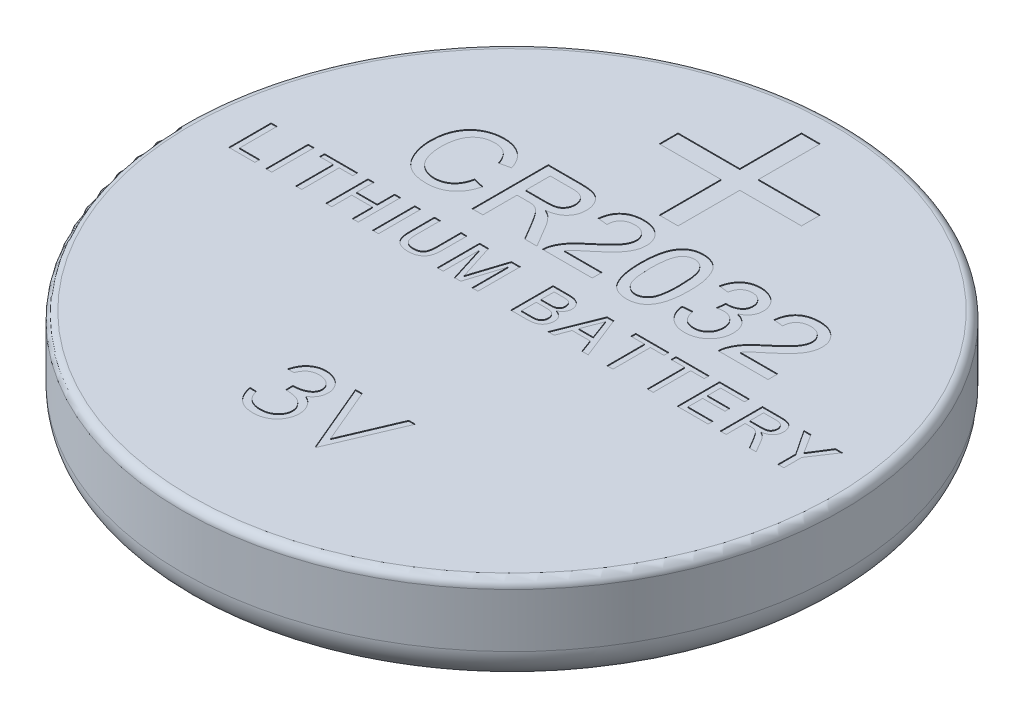
from build123d import *

# Parameters (mm, degrees)
SKETCH1_R           = 8.75
BOSS_EXTRUDE1_DEPTH = 3.2
SKETCH7_R           = 10
BOSS_EXTRUDE3_DEPTH = 2.9
CUT_EXTRUDE2_DEPTH  = 0.0254
FILLET3_R           = 0.15
FILLET5_R           = 0.254
FILLET4_R           = 1.016
CUT_EXTRUDE5_DEPTH  = 0.0254
SKETCH9_W           = 0.181099395
SKETCH9_H           = 1.284159342
CUT_EXTRUDE6_DEPTH  = 0.0254
CUT_EXTRUDE7_DEPTH  = 0.0254


with BuildPart() as part:
    # Sketch1 → Boss-Extrude1 (new body)
    with BuildSketch(Plane(origin=(0, 0, 0), x_dir=(1, 0, 0), z_dir=(0, 1, 0))):
        Circle(SKETCH1_R)
    extrude(amount=BOSS_EXTRUDE1_DEPTH)

    # Sketch7 → Boss-Extrude3 (add)
    with BuildSketch(Plane(origin=(0, 3.2, 0), x_dir=(1, 0, 0), z_dir=(0, 1, 0))):
        Circle(SKETCH7_R)
    extrude(amount=-BOSS_EXTRUDE3_DEPTH)

    # Sketch3 → Cut-Extrude2 (cut)
    with BuildSketch(Plane(origin=(0, 3.2, 0), x_dir=(1, 0, 0), z_dir=(0, 1, 0))):
        Polygon((-0.281880915, 7.193417617), (-0.281880915, 9.065853514), (0.28799088, 9.065853514), (0.28799088, 7.193417617), (2.160426778, 7.193417617), (2.160426778, 6.623545822), (0.28799088, 6.623545822), (0.28799088, 4.751109924), (-0.281880915, 4.751109924), (-0.281880915, 6.623545822), (-2.154316812, 6.623545822), (-2.154316812, 7.193417617), align=None)
    extrude(amount=-CUT_EXTRUDE2_DEPTH, mode=Mode.SUBTRACT)

    # Fillet3
    fillet3_edges = [part.edges().sort_by_distance(p)[0] for p in [
        (-8.75, 0, 0),
    ]]
    fillet(fillet3_edges, radius=FILLET3_R)

    # Fillet5
    fillet5_edges = [part.edges().sort_by_distance(p)[0] for p in [
        (-10, 3.2, 0),
    ]]
    fillet(fillet5_edges, radius=FILLET5_R)

    # Fillet4
    fillet4_edges = [part.edges().sort_by_distance(p)[0] for p in [
        (-10, 0.3, 0),
    ]]
    fillet(fillet4_edges, radius=FILLET4_R)

    # Sketch8 → Cut-Extrude5 (cut)
    # profile 1 of 6: a face of its own
    with BuildSketch(Plane(origin=(0, 3.2, 0), x_dir=(1, 0, 0), z_dir=(0, 1, 0))):
        with BuildLine():
            Line((5.689813702, 2.375680112), (5.689813702, 2.079335648))
            Line((5.689813702, 2.079335648), (4.178456937, 2.079335648))
            add(Edge.make_bspline(
                [(4.178456937, 2.079335648), (4.178425996, 2.096948233), (4.178364217, 2.132114368), (4.184314893, 2.184122853), (4.193634844, 2.2354414), (4.20417291, 2.268349944), (4.209480498, 2.28492462)],
                knots=[0, 0, 0, 0, 1.01057331, 2.01775941, 3.001627217, 4, 4, 4, 4], degree=3))
            add(Edge.make_bspline(
                [(4.209480498, 2.28492462), (4.219287156, 2.312005662), (4.239255127, 2.367147124), (4.279710445, 2.446708554), (4.327295459, 2.525788811), (4.373626169, 2.590171306), (4.416055094, 2.641608418), (4.451637278, 2.681852006), (4.491068861, 2.72304606), (4.534318264, 2.765183056), (4.580969238, 2.808535898), (4.631085437, 2.853249167), (4.685258656, 2.898489581), (4.723077232, 2.92847681), (4.742437495, 2.943828013)],
                knots=[0, 0, 0, 0, 1.204657718, 2.452881516, 3.728232997, 5.065887527, 5.768225529, 6.518857853, 7.313994055, 8.154655305, 9.046094665, 9.979688118, 10.965752482, 12, 12, 12, 12], degree=3))
            add(Edge.make_bspline(
                [(4.742437495, 2.943828013), (4.77217964, 2.968861494), (4.829450028, 3.01706505), (4.91032479, 3.088594659), (4.984190722, 3.155013953), (5.04987159, 3.217487065), (5.107904597, 3.275408047), (5.158426005, 3.328645671), (5.201870515, 3.377033793), (5.237707755, 3.422323859), (5.267944735, 3.465090278), (5.293567904, 3.506806279), (5.314921416, 3.548200549), (5.332706034, 3.589142105), (5.346772156, 3.629806031), (5.356360219, 3.670310801), (5.362862512, 3.710254508), (5.363513072, 3.736833493), (5.363834792, 3.749977562)],
                knots=[0, 0, 0, 0, 1.782554561, 3.432421876, 4.950675607, 6.337395053, 7.588547463, 8.709982106, 9.702713005, 10.569305638, 11.356701089, 12.103210377, 12.812277205, 13.490692607, 14.148717897, 14.782152033, 15.397739362, 16, 16, 16, 16], degree=3))
            add(Edge.make_bspline(
                [(5.363834792, 3.749977562), (5.363513033, 3.762968268), (5.362881759, 3.788455328), (5.356892265, 3.82575548), (5.348554409, 3.861676418), (5.335074634, 3.895571486), (5.319029643, 3.928444449), (5.298448069, 3.959256563), (5.27463942, 3.988775744), (5.247380531, 4.016223711), (5.217607441, 4.041974286), (5.184340256, 4.063379269), (5.149763955, 4.082650132), (5.112685685, 4.098145012), (5.073165697, 4.109523178), (5.031491677, 4.117780796), (4.987670238, 4.123016569), (4.957765186, 4.123741616), (4.942470008, 4.124112447)],
                knots=[0, 0, 0, 0, 0.988194508, 1.938783882, 2.870742509, 3.789494954, 4.709148727, 5.651055405, 6.603531303, 7.592354411, 8.592907906, 9.593461401, 10.59787167, 11.603930315, 12.645063138, 13.723588815, 14.835711238, 16, 16, 16, 16], degree=3))
            add(Edge.make_bspline(
                [(4.942470008, 4.124112447), (4.926402848, 4.123743452), (4.894958235, 4.123021303), (4.848994633, 4.117764649), (4.805360159, 4.109733193), (4.764158964, 4.097453783), (4.725441193, 4.081984742), (4.689364536, 4.06251334), (4.655351256, 4.040533649), (4.624472561, 4.014511352), (4.596549363, 3.985657933), (4.571760063, 3.954245288), (4.551448956, 3.919667218), (4.534675207, 3.882684017), (4.521187709, 3.843179424), (4.511396244, 3.800851434), (4.506057871, 3.755822263), (4.504984369, 3.7249863), (4.504435847, 3.709230198)],
                knots=[0, 0, 0, 0, 1.131143733, 2.213731411, 3.253917892, 4.251203413, 5.236093891, 6.184197493, 7.13373276, 8.082770301, 9.020476205, 9.957489029, 10.893177274, 11.836722509, 12.812818608, 13.827831385, 14.890097571, 16, 16, 16, 16], degree=3))
            Line((4.504435847, 3.709230198), (4.208091384, 3.738864644))
            add(Edge.make_bspline(
                [(4.208091384, 3.738864644), (4.211123409, 3.764691788), (4.217021952, 3.814936274), (4.231714419, 3.887706949), (4.252341313, 3.955404536), (4.277023132, 4.018972882), (4.307964118, 4.077329862), (4.342940239, 4.131682525), (4.384192961, 4.180307032), (4.429766273, 4.224736097), (4.480159482, 4.263889795), (4.534899222, 4.298095985), (4.593960451, 4.326707351), (4.657014221, 4.35039637), (4.724205288, 4.368369824), (4.795438597, 4.381258487), (4.870828705, 4.389203206), (4.922539698, 4.39027501), (4.948952543, 4.390822464)],
                knots=[0, 0, 0, 0, 1.130804643, 2.199883102, 3.223565206, 4.205909148, 5.160801384, 6.091796021, 7.01151579, 7.927798993, 8.855738875, 9.7815393, 10.730299821, 11.705391175, 12.706931101, 13.751121791, 14.851322166, 16, 16, 16, 16], degree=3))
            add(Edge.make_bspline(
                [(4.948952543, 4.390822464), (4.975681535, 4.390364761), (5.027749769, 4.389473151), (5.103621555, 4.380350196), (5.175208682, 4.366141277), (5.242773586, 4.346338394), (5.305917085, 4.320370909), (5.364687751, 4.288644506), (5.419356562, 4.251468667), (5.469010115, 4.20839712), (5.513784023, 4.161377311), (5.55302175, 4.111197039), (5.585826379, 4.058070675), (5.613757484, 4.002722367), (5.634475016, 3.943982643), (5.649043965, 3.88265008), (5.658943989, 3.818672266), (5.659762026, 3.775020058), (5.660179256, 3.752755791)],
                knots=[0, 0, 0, 0, 1.195390245, 2.328627238, 3.413424916, 4.457841177, 5.473507151, 6.462241215, 7.441013641, 8.425227782, 9.397253344, 10.342087291, 11.269524934, 12.186751184, 13.110685745, 14.048630397, 15.004728144, 16, 16, 16, 16], degree=3))
            add(Edge.make_bspline(
                [(5.660179256, 3.752755791), (5.659542153, 3.729881779), (5.658266542, 3.684083277), (5.648310225, 3.615628022), (5.631274856, 3.547915659), (5.608690504, 3.480122087), (5.577835579, 3.411978238), (5.53885562, 3.342544065), (5.490496721, 3.271563083), (5.443989019, 3.211221363), (5.400697897, 3.160639785), (5.362324408, 3.119008191), (5.317928503, 3.074777406), (5.269175637, 3.026415616), (5.214077435, 2.975639283), (5.154216996, 2.920927878), (5.088283946, 2.863721199), (5.04251356, 2.824640342), (5.018871315, 2.804453507)],
                knots=[0, 0, 0, 0, 0.927118007, 1.856282007, 2.79721255, 3.754929441, 4.749232485, 5.824981375, 6.979078785, 8.228161913, 8.911614355, 9.677694854, 10.522803217, 11.452009355, 12.461436787, 13.560019032, 14.739651695, 16, 16, 16, 16], degree=3))
            add(Edge.make_bspline(
                [(5.018871315, 2.804453507), (4.998625303, 2.787971095), (4.960019274, 2.756541673), (4.905094719, 2.710977597), (4.855899024, 2.669196573), (4.811281754, 2.63256142), (4.772867842, 2.599300142), (4.739304212, 2.570869436), (4.711810248, 2.545839818), (4.669941808, 2.507819324), (4.616911858, 2.453624951), (4.577837122, 2.400965793), (4.559074358, 2.375680112)],
                knots=[0, 0, 0, 0, 1.241996727, 2.368296581, 3.394949853, 4.3125351, 5.114548721, 5.812230366, 6.404953749, 6.883082049, 8.503329734, 10, 10, 10, 10], degree=3))
            Line((4.559074358, 2.375680112), (5.689813702, 2.375680112))
        make_face()
    # profile 2 of 6: a face of its own
    with BuildSketch(Plane(origin=(0, 3.2, 0), x_dir=(1, 0, 0), z_dir=(0, 1, 0))):
        with BuildLine():
            Line((2.459659048, 2.701659022), (2.756003512, 2.731293468))
            add(Edge.make_bspline(
                [(2.756003512, 2.731293468), (2.759954138, 2.713487338), (2.767598308, 2.679033796), (2.782306624, 2.629675518), (2.797841835, 2.58386), (2.817100746, 2.542612023), (2.835893257, 2.504244717), (2.857977303, 2.470343383), (2.881574535, 2.440023489), (2.907121187, 2.41339762), (2.934911637, 2.390469496), (2.964575378, 2.370406151), (2.996739771, 2.353650556), (3.031158556, 2.340384208), (3.067541846, 2.329644987), (3.106087364, 2.321759372), (3.146998935, 2.317061813), (3.175040495, 2.316631622), (3.18940729, 2.316411219)],
                knots=[0, 0, 0, 0, 1.321063709, 2.556160278, 3.730472002, 4.821700466, 5.852032229, 6.822994757, 7.746964065, 8.632786469, 9.490489437, 10.352773447, 11.223141997, 12.11199479, 13.021433979, 13.96892724, 14.959401504, 16, 16, 16, 16], degree=3))
            add(Edge.make_bspline(
                [(3.18940729, 2.316411219), (3.206259031, 2.316651484), (3.239170508, 2.317120722), (3.287127959, 2.324161083), (3.332767931, 2.333828171), (3.375439262, 2.348986717), (3.415736127, 2.367513262), (3.453428952, 2.390408142), (3.488775744, 2.417292461), (3.521079312, 2.448349088), (3.549968312, 2.482512367), (3.575698026, 2.518597509), (3.596973043, 2.556912418), (3.614904678, 2.596917416), (3.62814057, 2.639258966), (3.637830311, 2.683409089), (3.644162607, 2.729567451), (3.644741471, 2.761061051), (3.645036903, 2.777134252)],
                knots=[0, 0, 0, 0, 1.111377895, 2.170522867, 3.193923215, 4.186422864, 5.152846954, 6.117443035, 7.091571248, 8.078879332, 9.069127402, 10.041602243, 10.999610288, 11.957618333, 12.930786866, 13.922135183, 14.939532534, 16, 16, 16, 16], degree=3))
            add(Edge.make_bspline(
                [(3.645036903, 2.777134252), (3.644689684, 2.792430357), (3.644010378, 2.822355968), (3.638425931, 2.866280343), (3.628681195, 2.907976422), (3.615172662, 2.947685517), (3.597911529, 2.98534933), (3.577164156, 3.021279306), (3.551788418, 3.054688038), (3.523225787, 3.085934366), (3.492072289, 3.114721198), (3.457979571, 3.139208105), (3.422101219, 3.160341103), (3.384009644, 3.177405173), (3.343863005, 3.190949022), (3.301699573, 3.200683253), (3.257316636, 3.206270123), (3.227083531, 3.206949548), (3.211633125, 3.207296763)],
                knots=[0, 0, 0, 0, 1.072815875, 2.098878726, 3.09954706, 4.07199174, 5.036203424, 6.001873089, 6.97636515, 7.972747947, 8.969130744, 9.945905975, 10.911575641, 11.885646534, 12.868345115, 13.879560892, 14.916365174, 16, 16, 16, 16], degree=3))
            add(Edge.make_bspline(
                [(3.211633125, 3.207296763), (3.19802998, 3.206936373), (3.169160937, 3.206171541), (3.123595925, 3.199418365), (3.073124957, 3.189962335), (3.038248077, 3.180682644), (3.0199353, 3.175810163)],
                knots=[0, 0, 0, 0, 0.837610211, 1.777604146, 2.833088267, 4, 4, 4, 4], degree=3))
            Line((3.0199353, 3.175810163), (3.050495823, 3.442520181))
            add(Edge.make_bspline(
                [(3.050495823, 3.442520181), (3.058514189, 3.441643992), (3.072679883, 3.440096069), (3.086917012, 3.439526209), (3.093095339, 3.439278913)],
                knots=[0, 0, 0, 0, 1.132082448, 2, 2, 2, 2], degree=3))
            add(Edge.make_bspline(
                [(3.093095339, 3.439278913), (3.120349216, 3.440319456), (3.173812756, 3.442360673), (3.251752234, 3.45932148), (3.325615999, 3.486025722), (3.38268053, 3.517887758), (3.424997657, 3.547855733), (3.451681987, 3.574876114), (3.475739287, 3.603550196), (3.493687999, 3.636440407), (3.509194579, 3.67138705), (3.518796993, 3.709766767), (3.525799859, 3.750646647), (3.526261846, 3.778961162), (3.526499117, 3.793503155)],
                knots=[0, 0, 0, 0, 1.557468908, 3.055264441, 4.54122591, 6.035034992, 6.780215604, 7.498173296, 8.201377046, 8.913174237, 9.633083494, 10.382644491, 11.169345745, 12, 12, 12, 12], degree=3))
            add(Edge.make_bspline(
                [(3.526499117, 3.793503155), (3.526280134, 3.805249213), (3.525851863, 3.828221189), (3.521080738, 3.861900531), (3.513189882, 3.893812745), (3.502524606, 3.924298566), (3.488546702, 3.953198221), (3.471213004, 3.980476332), (3.451408666, 4.006686258), (3.428030346, 4.030473641), (3.402994193, 4.05280646), (3.375387242, 4.071615274), (3.346523378, 4.088324141), (3.315384637, 4.100950251), (3.282739762, 4.111330973), (3.2483097, 4.118605362), (3.212081885, 4.123490602), (3.187263226, 4.123902248), (3.174590067, 4.124112447)],
                knots=[0, 0, 0, 0, 1.041493611, 2.036867705, 3.009952345, 3.954088258, 4.897230656, 5.850851638, 6.817653571, 7.805463921, 8.805067469, 9.788883576, 10.763797054, 11.758134544, 12.762883247, 13.799594994, 14.876406454, 16, 16, 16, 16], degree=3))
            add(Edge.make_bspline(
                [(3.174590067, 4.124112447), (3.149789013, 4.123145413), (3.101894503, 4.121277927), (3.033323178, 4.103999809), (2.971185177, 4.076041565), (2.925181197, 4.04325435), (2.892514325, 4.011907917), (2.870201122, 3.985338201), (2.850243226, 3.955997486), (2.832584073, 3.92389623), (2.817462243, 3.888905335), (2.803830334, 3.851458284), (2.793277971, 3.81095555), (2.7882278, 3.782891149), (2.785637958, 3.768499091)],
                knots=[0, 0, 0, 0, 1.533565899, 2.961543033, 4.347411787, 5.731829577, 6.434842101, 7.147085226, 7.87612511, 8.629021686, 9.412189982, 10.234506416, 11.094615066, 12, 12, 12, 12], degree=3))
            Line((2.785637958, 3.768499091), (2.489293495, 3.798133537))
            add(Edge.make_bspline(
                [(2.489293495, 3.798133537), (2.493929207, 3.821047213), (2.503022521, 3.865994193), (2.521548562, 3.93090988), (2.544140841, 3.991847224), (2.571266669, 4.048526841), (2.601644534, 4.101627049), (2.636687606, 4.150518), (2.675574298, 4.195490356), (2.718373685, 4.236406946), (2.764504738, 4.272950036), (2.813735109, 4.304473247), (2.865660782, 4.331193711), (2.920330374, 4.352735132), (2.977700598, 4.370251571), (3.03793467, 4.381856256), (3.10075995, 4.38970624), (3.143541405, 4.390445812), (3.165329302, 4.390822464)],
                knots=[0, 0, 0, 0, 1.136581168, 2.229493434, 3.279335563, 4.293305329, 5.282068175, 6.250623624, 7.213783178, 8.169396253, 9.125981663, 10.071280146, 11.007896369, 11.961295906, 12.925420184, 13.920544621, 14.940967302, 16, 16, 16, 16], degree=3))
            add(Edge.make_bspline(
                [(3.165329302, 4.390822464), (3.195488939, 4.389844462), (3.254792535, 4.387921392), (3.341895697, 4.37264814), (3.425209414, 4.347584429), (3.504063265, 4.312841656), (3.57710061, 4.270386904), (3.641732641, 4.219507469), (3.697095314, 4.161083554), (3.742113332, 4.095753903), (3.777761288, 4.026197347), (3.804139703, 3.953994625), (3.819901202, 3.879228853), (3.821860793, 3.828612445), (3.822843581, 3.803226958)],
                knots=[0, 0, 0, 0, 1.104647871, 2.172094857, 3.229560912, 4.285649672, 5.322588163, 6.317201348, 7.289435229, 8.260615662, 9.214246199, 10.146367077, 11.070353327, 12, 12, 12, 12], degree=3))
            add(Edge.make_bspline(
                [(3.822843581, 3.803226958), (3.821847231, 3.779230134), (3.819879985, 3.731849556), (3.804734518, 3.662570757), (3.779141691, 3.596936885), (3.744549798, 3.534717661), (3.699692601, 3.477258626), (3.644693308, 3.426057388), (3.580431764, 3.380624029), (3.532273171, 3.356976468), (3.50751455, 3.344819115)],
                knots=[0, 0, 0, 0, 0.975609618, 1.926294443, 2.868398979, 3.832526731, 4.812148358, 5.820404151, 6.879456693, 8, 8, 8, 8], degree=3))
            add(Edge.make_bspline(
                [(3.50751455, 3.344819115), (3.524113554, 3.340628195), (3.556626157, 3.332419406), (3.603321629, 3.315411027), (3.647220614, 3.295498494), (3.688907381, 3.272945206), (3.727171684, 3.246272288), (3.76333246, 3.217108476), (3.796022747, 3.18404922), (3.826189642, 3.148272811), (3.853637813, 3.110153655), (3.876735718, 3.06895025), (3.896668538, 3.025745758), (3.913665352, 2.980226821), (3.925879225, 2.932042453), (3.93461253, 2.881565938), (3.940375798, 2.828972648), (3.941042892, 2.793047181), (3.941381366, 2.774819061)],
                knots=[0, 0, 0, 0, 1.053251915, 2.063013066, 3.05373318, 4.018979697, 4.975584284, 5.920798056, 6.874756953, 7.832116109, 8.799604348, 9.761196922, 10.734637845, 11.72654167, 12.747371341, 13.789206138, 14.878271633, 16, 16, 16, 16], degree=3))
            add(Edge.make_bspline(
                [(3.941381366, 2.774819061), (3.940817345, 2.749933293), (3.939708863, 2.701024772), (3.929200414, 2.629177042), (3.91202725, 2.560337257), (3.888261895, 2.494271651), (3.85814743, 2.430710598), (3.820358742, 2.370551053), (3.776015804, 2.313303999), (3.725811854, 2.259517557), (3.670808623, 2.210086162), (3.611077218, 2.1672833), (3.54779942, 2.130934435), (3.480872256, 2.101292115), (3.410473148, 2.078003501), (3.336532063, 2.061309479), (3.258820192, 2.05149823), (3.205796216, 2.050308094), (3.178757411, 2.049701202)],
                knots=[0, 0, 0, 0, 1.016055063, 1.996874249, 2.958724482, 3.910019225, 4.860394196, 5.826121543, 6.806008102, 7.814207964, 8.82789325, 9.821757317, 10.810247154, 11.803791187, 12.806673825, 13.834534493, 14.895752369, 16, 16, 16, 16], degree=3))
            add(Edge.make_bspline(
                [(3.178757411, 2.049701202), (3.154492327, 2.050158257), (3.106722622, 2.051058044), (3.036797637, 2.060432294), (2.969805867, 2.073735431), (2.906277044, 2.094243815), (2.845473226, 2.119253458), (2.788424207, 2.151249524), (2.734104205, 2.187979767), (2.683533007, 2.230493581), (2.636991464, 2.277417718), (2.595470841, 2.328058131), (2.559816799, 2.382302383), (2.528380772, 2.439338876), (2.502972332, 2.500242777), (2.483187839, 2.564491185), (2.468101898, 2.631845657), (2.462503952, 2.678134698), (2.459659048, 2.701659022)],
                knots=[0, 0, 0, 0, 1.08471039, 2.135426191, 3.150939737, 4.135689946, 5.116584603, 6.086901885, 7.055842759, 8.045878862, 9.036901429, 10.008421467, 10.96965771, 11.936653536, 12.917548193, 13.915472582, 14.940632654, 16, 16, 16, 16], degree=3))
        make_face()
    # profile 3 of 6: a face of its own
    with BuildSketch(Plane(origin=(0, 3.2, 0), x_dir=(1, 0, 0), z_dir=(0, 1, 0))):
        with BuildLine():
            add(Edge.make_bspline(
                [(0.681592266, 3.219335757), (0.681890833, 3.252369025), (0.682475601, 3.317067287), (0.686102722, 3.411732467), (0.692435382, 3.501632069), (0.701888299, 3.586688018), (0.713082325, 3.667092304), (0.727634629, 3.742730181), (0.744008086, 3.813771354), (0.763653297, 3.880141775), (0.785236952, 3.942412109), (0.809724298, 4.000482459), (0.837275883, 4.054291258), (0.866537719, 4.104396533), (0.899050209, 4.150018941), (0.932850965, 4.192438834), (0.970396422, 4.230100507), (1.010125361, 4.263973), (1.052622801, 4.293863502), (1.097663887, 4.319655399), (1.145075315, 4.342427785), (1.195760692, 4.359570831), (1.248667802, 4.373546047), (1.304203895, 4.383826386), (1.36243017, 4.389886993), (1.402219645, 4.390507118), (1.422453425, 4.390822464)],
                knots=[0, 0, 0, 0, 1.514747001, 2.966751498, 4.343369068, 5.64627492, 6.890416844, 8.064737671, 9.177176366, 10.232018008, 11.237056675, 12.19799043, 13.119080079, 14.007588942, 14.855863561, 15.685992447, 16.491747269, 17.290132607, 18.077525251, 18.870243746, 19.668095604, 20.485086593, 21.319398728, 22.175900658, 23.072407314, 24, 24, 24, 24], degree=3))
            add(Edge.make_bspline(
                [(1.422453425, 4.390822464), (1.452139013, 4.389949729), (1.510457541, 4.388235206), (1.595602893, 4.374251864), (1.675846899, 4.350331202), (1.751137426, 4.318061197), (1.820187394, 4.27707208), (1.881851925, 4.227243564), (1.935465869, 4.169098837), (1.980444112, 4.101948905), (2.019759585, 4.02764621), (2.054686589, 3.945857255), (2.086259586, 3.856673693), (2.108664472, 3.776841956), (2.124645859, 3.707928367), (2.135224267, 3.651090388), (2.144006467, 3.589761889), (2.150734818, 3.524091241), (2.156255272, 3.454152097), (2.160518466, 3.379900913), (2.162682473, 3.301152111), (2.163099931, 3.24711914), (2.163314585, 3.219335757)],
                knots=[0, 0, 0, 0, 1.134486744, 2.228744715, 3.287356444, 4.328707449, 5.352829806, 6.347195599, 7.349461267, 8.364207941, 9.428085653, 10.559314403, 11.761222316, 13.04268526, 13.726896727, 14.465273606, 15.252205015, 16.094778733, 16.988606776, 17.934225168, 18.937792761, 20, 20, 20, 20], degree=3))
            add(Edge.make_bspline(
                [(2.163314585, 3.219335757), (2.163010425, 3.18645765), (2.162416189, 3.122223798), (2.158886258, 3.028317673), (2.152172011, 2.93909632), (2.143910008, 2.854355359), (2.131411327, 2.774321008), (2.117943321, 2.698653222), (2.101286725, 2.6276956), (2.081852388, 2.561417043), (2.059964911, 2.499467093), (2.035961906, 2.441377568), (2.009376273, 2.38718816), (1.979416723, 2.337427407), (1.947454042, 2.291434816), (1.913254136, 2.249037861), (1.876091929, 2.210846755), (1.83600497, 2.177075861), (1.793805916, 2.146655295), (1.748655326, 2.120608753), (1.700750819, 2.099029646), (1.650412461, 2.080580582), (1.597129498, 2.06706219), (1.541322114, 2.056714072), (1.482784686, 2.05062035), (1.442841309, 2.050011812), (1.422453425, 2.049701202)],
                knots=[0, 0, 0, 0, 1.508974709, 2.94807912, 4.311757619, 5.615040294, 6.854280449, 8.028314546, 9.141715822, 10.197470207, 11.196696834, 12.155719058, 13.080757287, 13.963948316, 14.818758719, 15.649605906, 16.461113142, 17.260189315, 18.052359509, 18.845763934, 19.647754795, 20.461145776, 21.303032214, 22.167241874, 23.064524267, 24, 24, 24, 24], degree=3))
            add(Edge.make_bspline(
                [(1.422453425, 2.049701202), (1.395722546, 2.050463701), (1.343604688, 2.051950366), (1.267490399, 2.062051337), (1.196053079, 2.079829519), (1.128690195, 2.103672569), (1.066158924, 2.135564021), (1.008160705, 2.1743662), (0.953530104, 2.219176331), (0.922081409, 2.254530497), (0.906165805, 2.272422588)],
                knots=[0, 0, 0, 0, 1.10322584, 2.150986741, 3.161425019, 4.136713905, 5.093944212, 6.049774532, 7.013026876, 8, 8, 8, 8], degree=3))
            add(Edge.make_bspline(
                [(0.906165805, 2.272422588), (0.887846579, 2.298848341), (0.850071549, 2.353339375), (0.805859153, 2.446251642), (0.766420912, 2.548535004), (0.735469124, 2.662196246), (0.711226159, 2.786330755), (0.693716685, 2.921182109), (0.683808047, 3.066692047), (0.682347533, 3.167305906), (0.681592266, 3.219335757)],
                knots=[0, 0, 0, 0, 0.779365345, 1.607084704, 2.489375761, 3.438383567, 4.461919411, 5.557722155, 6.737039282, 8, 8, 8, 8], degree=3))
        make_face()
        with BuildLine():
            add(Edge.make_bspline(
                [(0.97793673, 3.220261833), (0.978230977, 3.175803534), (0.978794229, 3.090700516), (0.984678855, 2.969116173), (0.994808995, 2.859430498), (1.008201701, 2.76179536), (1.025885497, 2.676078688), (1.048089593, 2.602498913), (1.073118892, 2.540172912), (1.104092174, 2.489873168), (1.138004497, 2.448871539), (1.173016652, 2.413608812), (1.209952356, 2.383636301), (1.248570607, 2.35864534), (1.289470594, 2.339723826), (1.332205084, 2.326009471), (1.376783374, 2.31811707), (1.407143216, 2.31698308), (1.422453425, 2.316411219)],
                knots=[0, 0, 0, 0, 1.89448813, 3.626469325, 5.185477471, 6.587276848, 7.82441448, 8.910550357, 9.859733512, 10.6775885, 11.416198291, 12.123144072, 12.791880183, 13.439617036, 14.078171869, 14.70637855, 15.347637704, 16, 16, 16, 16], degree=3))
            add(Edge.make_bspline(
                [(1.422453425, 2.316411219), (1.437759802, 2.316995575), (1.468112041, 2.318154343), (1.512793333, 2.325872709), (1.555361553, 2.34029307), (1.596200558, 2.359147753), (1.635099498, 2.383569095), (1.671853799, 2.413654819), (1.707050392, 2.448896608), (1.740810382, 2.490374806), (1.771547691, 2.540907103), (1.797046508, 2.603182333), (1.818904566, 2.676890967), (1.836685396, 2.762563968), (1.850133349, 2.860044737), (1.860202241, 2.969426193), (1.866126248, 3.090854098), (1.866680205, 3.175803334), (1.866970121, 3.220261833)],
                knots=[0, 0, 0, 0, 0.652509534, 1.29391342, 1.924290653, 2.562989607, 3.207355802, 3.876242846, 4.583348185, 5.32723334, 6.150888545, 7.094226006, 8.186903555, 9.424320409, 10.81992305, 12.379283064, 14.105084285, 16, 16, 16, 16], degree=3))
            add(Edge.make_bspline(
                [(1.866970121, 3.220261833), (1.866689488, 3.263795295), (1.866151806, 3.347203761), (1.860075011, 3.466445779), (1.850552127, 3.574290424), (1.837526336, 3.670837119), (1.820215061, 3.755981048), (1.799218846, 3.829903472), (1.774198716, 3.89244674), (1.744449871, 3.944239098), (1.711333455, 3.986722883), (1.676740218, 4.023496296), (1.639805327, 4.054770885), (1.599874407, 4.079859822), (1.558234506, 4.100100643), (1.513928844, 4.114030891), (1.467392913, 4.1225892), (1.435455907, 4.123598897), (1.419212158, 4.124112447)],
                knots=[0, 0, 0, 0, 1.850066095, 3.544656626, 5.0727657, 6.45041401, 7.682899467, 8.762389858, 9.712573485, 10.538438529, 11.291566246, 11.996865408, 12.681389046, 13.341983376, 13.996294293, 14.643563182, 15.31009126, 16, 16, 16, 16], degree=3))
            add(Edge.make_bspline(
                [(1.419212158, 4.124112447), (1.40390291, 4.12371064), (1.373715034, 4.122918327), (1.32951603, 4.115355712), (1.287629153, 4.102709333), (1.247574515, 4.085578585), (1.210352059, 4.062523981), (1.174485635, 4.035606091), (1.141655086, 4.002809646), (1.121871686, 3.978291536), (1.111754777, 3.965753374)],
                knots=[0, 0, 0, 0, 1.021318143, 2.013908504, 2.982026795, 3.937174072, 4.91255697, 5.897578595, 6.924855925, 8, 8, 8, 8], degree=3))
            add(Edge.make_bspline(
                [(1.111754777, 3.965753374), (1.10074055, 3.947338698), (1.07748082, 3.908450778), (1.051454536, 3.840861971), (1.028463945, 3.76362083), (1.009535066, 3.675538943), (0.995841351, 3.576767408), (0.985030691, 3.467420927), (0.979414956, 3.347346841), (0.978443067, 3.263792274), (0.97793673, 3.220261833)],
                knots=[0, 0, 0, 0, 0.671104906, 1.417232262, 2.260109084, 3.195198885, 4.23592645, 5.382417421, 6.636286093, 8, 8, 8, 8], degree=3))
        make_face(mode=Mode.SUBTRACT)
    # profile 4 of 6: a face of its own
    with BuildSketch(Plane(origin=(0, 3.2, 0), x_dir=(1, 0, 0), z_dir=(0, 1, 0))):
        with BuildLine():
            Line((0.355613356, 2.375680112), (0.355613356, 2.079335648))
            Line((0.355613356, 2.079335648), (-1.155743408, 2.079335648))
            add(Edge.make_bspline(
                [(-1.155743408, 2.079335648), (-1.15577435, 2.096948233), (-1.155836129, 2.132114368), (-1.149885452, 2.184122853), (-1.140565501, 2.2354414), (-1.130027436, 2.268349944), (-1.124719847, 2.28492462)],
                knots=[0, 0, 0, 0, 1.01057331, 2.01775941, 3.001627217, 4, 4, 4, 4], degree=3))
            add(Edge.make_bspline(
                [(-1.124719847, 2.28492462), (-1.114913189, 2.312005662), (-1.094945218, 2.367147124), (-1.054489901, 2.446708554), (-1.006904886, 2.525788811), (-0.960574177, 2.590171306), (-0.918145252, 2.641608418), (-0.882563068, 2.681852006), (-0.843131485, 2.72304606), (-0.799882082, 2.765183056), (-0.753231108, 2.808535898), (-0.703114908, 2.853249167), (-0.64894169, 2.898489581), (-0.611123113, 2.92847681), (-0.591762851, 2.943828013)],
                knots=[0, 0, 0, 0, 1.204657718, 2.452881516, 3.728232997, 5.065887527, 5.768225529, 6.518857853, 7.313994055, 8.154655305, 9.046094665, 9.979688118, 10.965752482, 12, 12, 12, 12], degree=3))
            add(Edge.make_bspline(
                [(-0.591762851, 2.943828013), (-0.562020705, 2.968861494), (-0.504750317, 3.01706505), (-0.423875555, 3.088594659), (-0.350009624, 3.155013953), (-0.284328755, 3.217487065), (-0.226295748, 3.275408047), (-0.175774341, 3.328645671), (-0.132329831, 3.377033793), (-0.09649259, 3.422323859), (-0.066255611, 3.465090278), (-0.040632442, 3.506806279), (-0.01927893, 3.548200549), (-0.001494311, 3.589142105), (0.012571811, 3.629806031), (0.022159874, 3.670310801), (0.028662166, 3.710254508), (0.029312726, 3.736833493), (0.029634446, 3.749977562)],
                knots=[0, 0, 0, 0, 1.782554561, 3.432421876, 4.950675607, 6.337395053, 7.588547463, 8.709982106, 9.702713005, 10.569305638, 11.356701089, 12.103210377, 12.812277205, 13.490692607, 14.148717897, 14.782152033, 15.397739362, 16, 16, 16, 16], degree=3))
            add(Edge.make_bspline(
                [(0.029634446, 3.749977562), (0.029312687, 3.762968268), (0.028681414, 3.788455328), (0.02269192, 3.82575548), (0.014354063, 3.861676418), (0.000874288, 3.895571486), (-0.015170703, 3.928444449), (-0.035752276, 3.959256563), (-0.059560926, 3.988775744), (-0.086819815, 4.016223711), (-0.116592905, 4.041974286), (-0.14986009, 4.063379269), (-0.184436391, 4.082650132), (-0.22151466, 4.098145012), (-0.261034649, 4.109523178), (-0.302708669, 4.117780796), (-0.346530108, 4.123016569), (-0.376435159, 4.123741616), (-0.391730338, 4.124112447)],
                knots=[0, 0, 0, 0, 0.988194508, 1.938783882, 2.870742509, 3.789494954, 4.709148727, 5.651055405, 6.603531303, 7.592354411, 8.592907906, 9.593461401, 10.59787167, 11.603930315, 12.645063138, 13.723588815, 14.835711238, 16, 16, 16, 16], degree=3))
            add(Edge.make_bspline(
                [(-0.391730338, 4.124112447), (-0.407797498, 4.123743452), (-0.43924211, 4.123021303), (-0.485205713, 4.117764649), (-0.528840186, 4.109733193), (-0.570041382, 4.097453783), (-0.608759153, 4.081984742), (-0.644835809, 4.06251334), (-0.678849089, 4.040533649), (-0.709727784, 4.014511352), (-0.737650983, 3.985657933), (-0.762440283, 3.954245288), (-0.782751389, 3.919667218), (-0.799525138, 3.882684017), (-0.813012637, 3.843179424), (-0.822804102, 3.800851434), (-0.828142474, 3.755822263), (-0.829215976, 3.7249863), (-0.829764498, 3.709230198)],
                knots=[0, 0, 0, 0, 1.131143733, 2.213731411, 3.253917892, 4.251203413, 5.236093891, 6.184197493, 7.13373276, 8.082770301, 9.020476205, 9.957489029, 10.893177274, 11.836722509, 12.812818608, 13.827831385, 14.890097571, 16, 16, 16, 16], degree=3))
            Line((-0.829764498, 3.709230198), (-1.126108962, 3.738864644))
            add(Edge.make_bspline(
                [(-1.126108962, 3.738864644), (-1.123076937, 3.764691788), (-1.117178394, 3.814936274), (-1.102485927, 3.887706949), (-1.081859033, 3.955404536), (-1.057177214, 4.018972882), (-1.026236228, 4.077329862), (-0.991260106, 4.131682525), (-0.950007385, 4.180307032), (-0.904434072, 4.224736097), (-0.854040863, 4.263889795), (-0.799301124, 4.298095985), (-0.740239894, 4.326707351), (-0.677186124, 4.35039637), (-0.609995058, 4.368369824), (-0.538761749, 4.381258487), (-0.463371641, 4.389203206), (-0.411660648, 4.39027501), (-0.385247803, 4.390822464)],
                knots=[0, 0, 0, 0, 1.130804643, 2.199883102, 3.223565206, 4.205909148, 5.160801384, 6.091796021, 7.01151579, 7.927798993, 8.855738875, 9.7815393, 10.730299821, 11.705391175, 12.706931101, 13.751121791, 14.851322166, 16, 16, 16, 16], degree=3))
            add(Edge.make_bspline(
                [(-0.385247803, 4.390822464), (-0.358518811, 4.390364761), (-0.306450577, 4.389473151), (-0.230578791, 4.380350196), (-0.158991664, 4.366141277), (-0.09142676, 4.346338394), (-0.02828326, 4.320370909), (0.030487405, 4.288644506), (0.085156216, 4.251468667), (0.13480977, 4.20839712), (0.179583677, 4.161377311), (0.218821405, 4.111197039), (0.251626034, 4.058070675), (0.279557139, 4.002722367), (0.30027467, 3.943982643), (0.31484362, 3.88265008), (0.324743644, 3.818672266), (0.325561681, 3.775020058), (0.32597891, 3.752755791)],
                knots=[0, 0, 0, 0, 1.195390245, 2.328627238, 3.413424916, 4.457841177, 5.473507151, 6.462241215, 7.441013641, 8.425227782, 9.397253344, 10.342087291, 11.269524934, 12.186751184, 13.110685745, 14.048630397, 15.004728144, 16, 16, 16, 16], degree=3))
            add(Edge.make_bspline(
                [(0.32597891, 3.752755791), (0.325341807, 3.729881779), (0.324066196, 3.684083277), (0.314109879, 3.615628022), (0.297074511, 3.547915659), (0.274490159, 3.480122087), (0.243635233, 3.411978238), (0.204655274, 3.342544065), (0.156296375, 3.271563083), (0.109788674, 3.211221363), (0.066497551, 3.160639785), (0.028124063, 3.119008191), (-0.016271843, 3.074777406), (-0.065024708, 3.026415616), (-0.120122911, 2.975639283), (-0.17998335, 2.920927878), (-0.245916399, 2.863721199), (-0.291686785, 2.824640342), (-0.315329031, 2.804453507)],
                knots=[0, 0, 0, 0, 0.927118007, 1.856282007, 2.79721255, 3.754929441, 4.749232485, 5.824981375, 6.979078785, 8.228161913, 8.911614355, 9.677694854, 10.522803217, 11.452009355, 12.461436787, 13.560019032, 14.739651695, 16, 16, 16, 16], degree=3))
            add(Edge.make_bspline(
                [(-0.315329031, 2.804453507), (-0.335575043, 2.787971095), (-0.374181072, 2.756541673), (-0.429105626, 2.710977597), (-0.478301322, 2.669196573), (-0.522918591, 2.63256142), (-0.561332503, 2.599300142), (-0.594896134, 2.570869436), (-0.622390098, 2.545839818), (-0.664258537, 2.507819324), (-0.717288488, 2.453624951), (-0.756363224, 2.400965793), (-0.775125988, 2.375680112)],
                knots=[0, 0, 0, 0, 1.241996727, 2.368296581, 3.394949853, 4.3125351, 5.114548721, 5.812230366, 6.404953749, 6.883082049, 8.503329734, 10, 10, 10, 10], degree=3))
            Line((-0.775125988, 2.375680112), (0.355613356, 2.375680112))
        make_face()
    # profile 5 of 6: a face of its own
    with BuildSketch(Plane(origin=(0, 3.2, 0), x_dir=(1, 0, 0), z_dir=(0, 1, 0))):
        with BuildLine():
            Line((-3.289423546, 2.079335648), (-3.289423546, 4.390822464))
            Line((-3.289423546, 4.390822464), (-2.286482752, 4.390822464))
            add(Edge.make_bspline(
                [(-2.286482752, 4.390822464), (-2.262866568, 4.390637422), (-2.217160206, 4.390279294), (-2.150876545, 4.387744152), (-2.089007392, 4.382279053), (-2.031438991, 4.376369309), (-1.97818157, 4.367298642), (-1.929290072, 4.356894792), (-1.884689014, 4.344514052), (-1.844178999, 4.329891445), (-1.806594539, 4.313348156), (-1.771756583, 4.292936407), (-1.738216963, 4.270569483), (-1.707220451, 4.244291685), (-1.677949511, 4.215519929), (-1.650431272, 4.183863267), (-1.62507312, 4.149046984), (-1.593796876, 4.099217663), (-1.560243843, 4.0328555), (-1.532288896, 3.947926312), (-1.514264046, 3.85908728), (-1.512335336, 3.798376093), (-1.511356765, 3.767573014)],
                knots=[0, 0, 0, 0, 1.242255013, 2.404239178, 3.487702428, 4.508875116, 5.447164253, 6.327763259, 7.137389581, 7.87956647, 8.591787438, 9.293660819, 10.000726923, 10.709654955, 11.427269343, 12.158170644, 12.913245971, 13.690346794, 15.251572448, 16.809945773, 18.381459854, 20, 20, 20, 20], degree=3))
            add(Edge.make_bspline(
                [(-1.511356765, 3.767573014), (-1.511809082, 3.747800185), (-1.512702441, 3.70874749), (-1.519545659, 3.651329576), (-1.531927908, 3.596469067), (-1.547805702, 3.543685507), (-1.569537559, 3.493726752), (-1.594712972, 3.445572381), (-1.625901729, 3.400545323), (-1.660820991, 3.357446579), (-1.700864021, 3.317199209), (-1.746383076, 3.281255239), (-1.796926936, 3.248923566), (-1.852733643, 3.221096234), (-1.913160805, 3.195660731), (-1.978966617, 3.175178839), (-2.049885492, 3.158453803), (-2.099049753, 3.150354895), (-2.124419374, 3.146175717)],
                knots=[0, 0, 0, 0, 0.982609109, 1.940720374, 2.867584677, 3.775009516, 4.675469332, 5.571146231, 6.471115823, 7.392408543, 8.32534739, 9.286126426, 10.269214477, 11.301811357, 12.381622301, 13.524260118, 14.722474812, 16, 16, 16, 16], degree=3))
            add(Edge.make_bspline(
                [(-2.124419374, 3.146175717), (-2.105809796, 3.136774569), (-2.070469537, 3.11892145), (-2.021540512, 3.090927914), (-1.980065071, 3.062325419), (-1.956036246, 3.041868074), (-1.944760543, 3.032268314)],
                knots=[0, 0, 0, 0, 1.172304973, 2.226249348, 3.167654437, 4, 4, 4, 4], degree=3))
            add(Edge.make_bspline(
                [(-1.944760543, 3.032268314), (-1.922924507, 3.010862617), (-1.878071737, 2.966893796), (-1.816262673, 2.892002013), (-1.756336662, 2.808635966), (-1.719927092, 2.748387041), (-1.701202437, 2.717402321)],
                knots=[0, 0, 0, 0, 0.918110279, 1.885863737, 2.912745394, 4, 4, 4, 4], degree=3))
            Line((-1.701202437, 2.717402321), (-1.321974131, 2.079335648))
            Line((-1.321974131, 2.079335648), (-1.695645978, 2.079335648))
            Line((-1.695645978, 2.079335648), (-1.983655754, 2.567377937))
            add(Edge.make_bspline(
                [(-1.983655754, 2.567377937), (-1.994011138, 2.584501487), (-2.014078174, 2.617684116), (-2.043064288, 2.666145748), (-2.07148422, 2.710762402), (-2.09784322, 2.752809245), (-2.123210982, 2.79152294), (-2.147342393, 2.827037968), (-2.169573346, 2.859820242), (-2.197109256, 2.897987339), (-2.229156481, 2.940219586), (-2.266553394, 2.983710826), (-2.302166344, 3.018385813), (-2.346024348, 3.052388325), (-2.400349121, 3.084191961), (-2.446526204, 3.098804857), (-2.468919813, 3.105891392)],
                knots=[0, 0, 0, 0, 1.130940588, 2.191577161, 3.191089816, 4.120344442, 4.99615009, 5.80661983, 6.546979556, 7.234477901, 8.466216387, 9.541989141, 10.473533583, 11.269175393, 12.675684693, 14, 14, 14, 14], degree=3))
            add(Edge.make_bspline(
                [(-2.468919813, 3.105891392), (-2.478315341, 3.107585725), (-2.499765614, 3.111453938), (-2.536188123, 3.113980274), (-2.580318461, 3.116661642), (-2.61230047, 3.116583516), (-2.629594077, 3.116541271)],
                knots=[0, 0, 0, 0, 0.709978628, 1.620902492, 2.713552433, 4, 4, 4, 4], degree=3))
            Line((-2.629594077, 3.116541271), (-2.963444636, 3.116541271))
            Line((-2.963444636, 3.116541271), (-2.963444636, 2.079335648))
            Line((-2.963444636, 2.079335648), (-3.289423546, 2.079335648))
        make_face()
        with BuildLine():
            Line((-2.963444636, 3.383251288), (-2.34436253, 3.383251288))
            add(Edge.make_bspline(
                [(-2.34436253, 3.383251288), (-2.313319409, 3.383736987), (-2.255287204, 3.384644956), (-2.174138347, 3.392398056), (-2.104981464, 3.404718061), (-2.046449425, 3.422688231), (-1.997273272, 3.447636794), (-1.954503838, 3.478041281), (-1.9189619, 3.516126066), (-1.889394679, 3.559096637), (-1.866411471, 3.606383605), (-1.849832482, 3.656051633), (-1.838981245, 3.707683292), (-1.837889056, 3.742823084), (-1.837335675, 3.760627441)],
                knots=[0, 0, 0, 0, 1.546323217, 2.890706218, 4.056530419, 5.041445823, 5.928701482, 6.793137403, 7.641659452, 8.509781392, 9.383301667, 10.251423607, 11.114044887, 12, 12, 12, 12], degree=3))
            add(Edge.make_bspline(
                [(-1.837335675, 3.760627441), (-1.837765906, 3.773602153), (-1.838608602, 3.799015802), (-1.843026294, 3.836315984), (-1.851615338, 3.871759778), (-1.862957148, 3.905534545), (-1.878112108, 3.937392908), (-1.896115583, 3.967581734), (-1.917599285, 3.995933705), (-1.942207631, 4.022535186), (-1.970462484, 4.046739933), (-2.002736168, 4.067623381), (-2.038774143, 4.085369806), (-2.078618298, 4.099454555), (-2.122143115, 4.110720061), (-2.169596373, 4.11821464), (-2.220761056, 4.123637692), (-2.256215215, 4.123951239), (-2.274443758, 4.124112447)],
                knots=[0, 0, 0, 0, 0.965208469, 1.890559848, 2.786986821, 3.67262109, 4.535197034, 5.405224191, 6.282113641, 7.175449223, 8.095446547, 9.040936516, 10.026471658, 11.075712529, 12.17809725, 13.364958037, 14.645208957, 16, 16, 16, 16], degree=3))
            Line((-2.274443758, 4.124112447), (-2.963444636, 4.124112447))
            Line((-2.963444636, 4.124112447), (-2.963444636, 3.383251288))
        make_face(mode=Mode.SUBTRACT)
    # profile 6 of 6: a face of its own
    with BuildSketch(Plane(origin=(0, 3.2, 0), x_dir=(1, 0, 0), z_dir=(0, 1, 0))):
        with BuildLine():
            Line((-4.030284706, 2.895208999), (-3.704305796, 2.819270731))
            add(Edge.make_bspline(
                [(-3.704305796, 2.819270731), (-3.712472477, 2.788717633), (-3.72844752, 2.728951982), (-3.76003212, 2.643420719), (-3.795481961, 2.563153278), (-3.835657215, 2.488361096), (-3.880997597, 2.419474183), (-3.930301771, 2.355607208), (-3.985522604, 2.298099522), (-4.04463398, 2.245623879), (-4.108096144, 2.199340501), (-4.175143959, 2.159373956), (-4.245453333, 2.125370538), (-4.319308432, 2.097408216), (-4.396757138, 2.076364171), (-4.477400666, 2.061026038), (-4.561474167, 2.051578641), (-4.618781549, 2.050334864), (-4.647977697, 2.049701202)],
                knots=[0, 0, 0, 0, 1.145254194, 2.240259345, 3.299159039, 4.322497661, 5.312016644, 6.284080175, 7.241264552, 8.196044782, 9.144516039, 10.082428046, 11.020306713, 11.970622414, 12.939253955, 13.924100776, 14.94240044, 16, 16, 16, 16], degree=3))
            add(Edge.make_bspline(
                [(-4.647977697, 2.049701202), (-4.67793351, 2.050136406), (-4.736539666, 2.050987848), (-4.822394305, 2.057913253), (-4.904050497, 2.069924289), (-4.981355751, 2.086611906), (-5.054570268, 2.107245106), (-5.123390446, 2.133203501), (-5.187695746, 2.16429979), (-5.248022557, 2.199664307), (-5.304114653, 2.239839991), (-5.357247587, 2.28374261), (-5.406131467, 2.332580753), (-5.451988576, 2.385201307), (-5.493820129, 2.442298411), (-5.533165119, 2.503096376), (-5.568103139, 2.568666459), (-5.599928964, 2.637792991), (-5.627863171, 2.709806701), (-5.652575174, 2.783285119), (-5.672778587, 2.858374661), (-5.690172422, 2.93444346), (-5.7028082, 3.012131582), (-5.712840617, 3.09085613), (-5.718356641, 3.171099753), (-5.719082492, 3.22503893), (-5.719448148, 3.25221147)],
                knots=[0, 0, 0, 0, 1.180702053, 2.309949215, 3.392367133, 4.431746864, 5.425408375, 6.388154007, 7.326956194, 8.237882283, 9.141054626, 10.043899035, 10.951650021, 11.86168169, 12.792564695, 13.739356664, 14.713891418, 15.718426911, 16.737522708, 17.757217648, 18.772674716, 19.801476837, 20.831699174, 21.873853055, 22.928926693, 24, 24, 24, 24], degree=3))
            add(Edge.make_bspline(
                [(-5.719448148, 3.25221147), (-5.718925183, 3.281545323), (-5.717891935, 3.339501607), (-5.712059266, 3.425017787), (-5.701346768, 3.507551362), (-5.686470224, 3.587156621), (-5.667645444, 3.663898033), (-5.644408364, 3.737812986), (-5.617052931, 3.808806906), (-5.585662543, 3.876958079), (-5.550028648, 3.941505759), (-5.511214771, 4.002541703), (-5.468295053, 4.05906373), (-5.422542, 4.112151709), (-5.372812898, 4.160921665), (-5.319259598, 4.205484073), (-5.262344135, 4.246245399), (-5.202074817, 4.282827231), (-5.139239434, 4.314925875), (-5.074771293, 4.343516417), (-5.008413978, 4.366950252), (-4.940693587, 4.386434545), (-4.871464326, 4.401945851), (-4.800564432, 4.41231831), (-4.728059418, 4.419077808), (-4.679170875, 4.419993882), (-4.654460232, 4.420456911)],
                knots=[0, 0, 0, 0, 1.185634383, 2.342514083, 3.462112933, 4.547331452, 5.613960142, 6.653690668, 7.676612054, 8.686959706, 9.683658101, 10.654407272, 11.607580201, 12.5494388, 13.484601218, 14.419076806, 15.362504069, 16.311442244, 17.265594461, 18.212500624, 19.159571152, 20.107257795, 21.059246075, 22.024387127, 23.001429356, 24, 24, 24, 24], degree=3))
            add(Edge.make_bspline(
                [(-4.654460232, 4.420456911), (-4.626812352, 4.419935762), (-4.572467705, 4.418911392), (-4.492726619, 4.410485749), (-4.416355479, 4.396373721), (-4.343023354, 4.377860073), (-4.273492665, 4.352511037), (-4.207008537, 4.322373945), (-4.144232354, 4.286167881), (-4.084675665, 4.244887851), (-4.029307961, 4.198457726), (-3.97735443, 4.147986708), (-3.930933464, 4.092213392), (-3.88820651, 4.032487589), (-3.850517901, 3.967981108), (-3.816481111, 3.899256375), (-3.787210462, 3.8258025), (-3.771549207, 3.774639845), (-3.763574688, 3.748588447)],
                knots=[0, 0, 0, 0, 1.098391872, 2.158997981, 3.181470371, 4.182549255, 5.160268219, 6.118029851, 7.079534476, 8.035645336, 8.993622929, 9.94770573, 10.909620999, 11.872786677, 12.862530088, 13.874594564, 14.917769567, 16, 16, 16, 16], degree=3))
            Line((-3.763574688, 3.748588447), (-4.089553598, 3.678669675))
            add(Edge.make_bspline(
                [(-4.089553598, 3.678669675), (-4.095955315, 3.698662785), (-4.108485456, 3.737795488), (-4.130733947, 3.793566545), (-4.154761575, 3.845340307), (-4.181140699, 3.892764839), (-4.209928487, 3.935851501), (-4.240462033, 3.975123948), (-4.27347289, 4.009849154), (-4.308289591, 4.040827794), (-4.345811203, 4.067218631), (-4.385158059, 4.090605256), (-4.427159785, 4.109954122), (-4.471212156, 4.126319265), (-4.517726924, 4.138774902), (-4.566514677, 4.147537935), (-4.617618278, 4.152609548), (-4.652442512, 4.153362748), (-4.670203532, 4.153746893)],
                knots=[0, 0, 0, 0, 1.235697765, 2.418642872, 3.532555292, 4.594392283, 5.610119701, 6.580908344, 7.519430642, 8.427315627, 9.319973334, 10.216139639, 11.118687699, 12.038725643, 12.980015607, 13.949697744, 14.954307006, 16, 16, 16, 16], degree=3))
            add(Edge.make_bspline(
                [(-4.670203532, 4.153746893), (-4.690594807, 4.153451036), (-4.730698427, 4.152869173), (-4.789615469, 4.146500739), (-4.846196322, 4.137120658), (-4.90001929, 4.12305442), (-4.951378897, 4.105517478), (-4.999970366, 4.083680884), (-5.046207036, 4.058085833), (-5.089572884, 4.028578626), (-5.129703459, 3.995406846), (-5.167687789, 3.960339084), (-5.201702203, 3.92173986), (-5.233043774, 3.880881944), (-5.260799837, 3.837043346), (-5.285784942, 3.790821202), (-5.30783983, 3.741836683), (-5.331881156, 3.672894684), (-5.35639451, 3.584098983), (-5.377659874, 3.475441826), (-5.39120541, 3.365072782), (-5.392713033, 3.290836552), (-5.393469238, 3.253600585)],
                knots=[0, 0, 0, 0, 0.935256702, 1.839373932, 2.716087708, 3.564631604, 4.388828665, 5.203538865, 6.005592122, 6.810952829, 7.606223804, 8.392839071, 9.180346482, 9.963639178, 10.753404291, 11.558266631, 12.372976832, 13.215232055, 14.905983541, 16.594894834, 18.292041732, 20, 20, 20, 20], degree=3))
            add(Edge.make_bspline(
                [(-5.393469238, 3.253600585), (-5.392616346, 3.206782588), (-5.390961659, 3.115951435), (-5.37463396, 2.984322089), (-5.349740144, 2.861547341), (-5.319696895, 2.765758574), (-5.289560497, 2.695102977), (-5.265187693, 2.645621843), (-5.237367109, 2.599834402), (-5.206790745, 2.557480621), (-5.173064746, 2.518684046), (-5.136658982, 2.483238586), (-5.097565321, 2.450803173), (-5.055320541, 2.422896167), (-5.011550695, 2.398117179), (-4.966808124, 2.376083229), (-4.921064658, 2.35744789), (-4.874135741, 2.34297158), (-4.82668038, 2.330462035), (-4.778175904, 2.322290214), (-4.728636143, 2.317678295), (-4.695371419, 2.316836964), (-4.67853822, 2.316411219)],
                knots=[0, 0, 0, 0, 2.10686522, 4.087509323, 5.961373225, 7.741398778, 8.594514555, 9.418024779, 10.222433421, 11.003575649, 11.767087398, 12.533660211, 13.289033706, 14.050297079, 14.809623433, 15.552362432, 16.294320901, 17.0305302, 17.761969017, 18.502233515, 19.242073914, 20, 20, 20, 20], degree=3))
            add(Edge.make_bspline(
                [(-4.67853822, 2.316411219), (-4.658450101, 2.316832509), (-4.618768964, 2.317664706), (-4.560591378, 2.324948972), (-4.504508987, 2.335683292), (-4.451201221, 2.35224743), (-4.399951032, 2.372528278), (-4.351178325, 2.397538109), (-4.305036485, 2.427617637), (-4.26098278, 2.461770115), (-4.219829602, 2.500629799), (-4.182114926, 2.543883617), (-4.148280601, 2.591728755), (-4.116907667, 2.643397371), (-4.090548636, 2.700432995), (-4.06613395, 2.761135647), (-4.04578987, 2.826503029), (-4.035527338, 2.871978019), (-4.030284706, 2.895208999)],
                knots=[0, 0, 0, 0, 1.013374089, 2.001772144, 2.95501459, 3.891367103, 4.814208647, 5.733921849, 6.652182523, 7.590185968, 8.54346024, 9.504121027, 10.481158517, 11.497760682, 12.549996529, 13.647863555, 14.798406869, 16, 16, 16, 16], degree=3))
        make_face()
    extrude(amount=-CUT_EXTRUDE5_DEPTH, mode=Mode.SUBTRACT)

    # Sketch9 → Cut-Extrude6 (cut)
    # profile 1 of 14: a face of its own
    with BuildSketch(Plane(origin=(0, 3.2, 0), x_dir=(1, 0, 0), z_dir=(0, 1, 0))):
        with BuildLine():
            Line((8.06730919, 0), (8.06730919, 0.544069914))
            Line((8.06730919, 0.544069914), (7.57340175, 1.284159342))
            Line((7.57340175, 1.284159342), (7.787685551, 1.284159342))
            Line((7.787685551, 1.284159342), (8.036697218, 0.891605826))
            add(Edge.make_bspline(
                [(8.036697218, 0.891605826), (8.047853594, 0.874119095), (8.069501349, 0.840187962), (8.100786347, 0.790820212), (8.13027948, 0.744708328), (8.149043888, 0.714890366), (8.15811613, 0.700473936)],
                knots=[0, 0, 0, 0, 1.099240192, 2.132958167, 3.097319992, 4, 4, 4, 4], degree=3))
            add(Edge.make_bspline(
                [(8.15811613, 0.700473936), (8.167215129, 0.71470188), (8.186656792, 0.745102464), (8.217433391, 0.793694673), (8.251991705, 0.848003169), (8.276116835, 0.886196291), (8.288795807, 0.906268703)],
                knots=[0, 0, 0, 0, 0.831336673, 1.776301659, 2.8313344, 4, 4, 4, 4], degree=3))
            Line((8.288795807, 0.906268703), (8.528032223, 1.284159342))
            Line((8.528032223, 1.284159342), (8.742316024, 1.284159342))
            Line((8.742316024, 1.284159342), (8.248408584, 0.544069914))
            Line((8.248408584, 0.544069914), (8.248408584, 0))
            Line((8.248408584, 0), (8.06730919, 0))
        make_face()
    # profile 2 of 14: a face of its own
    with BuildSketch(Plane(origin=(0, 3.2, 0), x_dir=(1, 0, 0), z_dir=(0, 1, 0))):
        with BuildLine():
            Line((6.31707615, 0), (6.31707615, 1.284159342))
            Line((6.31707615, 1.284159342), (6.87426548, 1.284159342))
            add(Edge.make_bspline(
                [(6.87426548, 1.284159342), (6.887385583, 1.284056541), (6.912778006, 1.283857581), (6.949602262, 1.282449169), (6.983974014, 1.279413003), (7.015956459, 1.276129812), (7.045543915, 1.271090552), (7.072705858, 1.265310635), (7.097484224, 1.258432447), (7.119989787, 1.250308776), (7.140870043, 1.24111806), (7.160224463, 1.2297782), (7.178857585, 1.217352131), (7.196077869, 1.202753354), (7.212339503, 1.186769045), (7.227627413, 1.169182011), (7.241715276, 1.149839631), (7.259090967, 1.122156675), (7.277731541, 1.085288807), (7.293262067, 1.038105924), (7.303275872, 0.988750907), (7.304347378, 0.95502247), (7.304891029, 0.937909648)],
                knots=[0, 0, 0, 0, 1.242255013, 2.404239178, 3.487702428, 4.508875116, 5.447164253, 6.327763259, 7.137389581, 7.87956647, 8.591787438, 9.293660819, 10.000726923, 10.709654955, 11.427269343, 12.158170644, 12.913245971, 13.690346794, 15.251572448, 16.809945773, 18.381459854, 20, 20, 20, 20], degree=3))
            add(Edge.make_bspline(
                [(7.304891029, 0.937909648), (7.304639741, 0.926924743), (7.304143431, 0.905228801), (7.300341643, 0.87332996), (7.293462616, 0.8428519), (7.284641619, 0.813527699), (7.272568365, 0.785772836), (7.258582025, 0.759020407), (7.241254938, 0.734005375), (7.221855347, 0.710061628), (7.19960922, 0.687701978), (7.174320856, 0.667733106), (7.146240933, 0.649771066), (7.115237207, 0.634311437), (7.081666562, 0.620180602), (7.045107778, 0.608801773), (7.005708402, 0.599510086), (6.978394924, 0.595010693), (6.96430069, 0.592688927)],
                knots=[0, 0, 0, 0, 0.982609109, 1.940720374, 2.867584677, 3.775009516, 4.675469332, 5.571146231, 6.471115823, 7.392408543, 8.32534739, 9.286126426, 10.269214477, 11.301811357, 12.381622301, 13.524260118, 14.722474812, 16, 16, 16, 16], degree=3))
            add(Edge.make_bspline(
                [(6.96430069, 0.592688927), (6.974639345, 0.587466067), (6.994272822, 0.577547668), (7.021455614, 0.561995703), (7.044497525, 0.546105428), (7.057846873, 0.534740237), (7.064111152, 0.529407037)],
                knots=[0, 0, 0, 0, 1.172304973, 2.226249348, 3.167654437, 4, 4, 4, 4], degree=3))
            add(Edge.make_bspline(
                [(7.064111152, 0.529407037), (7.076242283, 0.517514983), (7.101160488, 0.49308786), (7.135498858, 0.451481314), (7.168791086, 0.405166843), (7.189018625, 0.371695219), (7.199421211, 0.354481485)],
                knots=[0, 0, 0, 0, 0.918110279, 1.885863737, 2.912745394, 4, 4, 4, 4], degree=3))
            Line((7.199421211, 0.354481485), (7.410103603, 0))
            Line((7.410103603, 0), (7.202508132, 0))
            Line((7.202508132, 0), (7.042502702, 0.271134605))
            add(Edge.make_bspline(
                [(7.042502702, 0.271134605), (7.03674971, 0.280647688), (7.025601357, 0.299082482), (7.00949796, 0.326005611), (6.993709109, 0.350792641), (6.97906522, 0.374151999), (6.964972019, 0.395659607), (6.95156568, 0.415390178), (6.93921515, 0.433602552), (6.923917423, 0.454806495), (6.906113408, 0.478268855), (6.885337345, 0.502430655), (6.865552374, 0.521694536), (6.841186816, 0.540584821), (6.811006386, 0.558253507), (6.785352451, 0.566371783), (6.772911558, 0.570308746)],
                knots=[0, 0, 0, 0, 1.130940588, 2.191577161, 3.191089816, 4.120344442, 4.99615009, 5.80661983, 6.546979556, 7.234477901, 8.466216387, 9.541989141, 10.473533583, 11.269175393, 12.675684693, 14, 14, 14, 14], degree=3))
            add(Edge.make_bspline(
                [(6.772911558, 0.570308746), (6.76769182, 0.571250043), (6.755775002, 0.57339905), (6.735540274, 0.57480257), (6.711023419, 0.576292219), (6.693255637, 0.576248815), (6.683648078, 0.576225346)],
                knots=[0, 0, 0, 0, 0.709978628, 1.620902492, 2.713552433, 4, 4, 4, 4], degree=3))
            Line((6.683648078, 0.576225346), (6.498175544, 0.576225346))
            Line((6.498175544, 0.576225346), (6.498175544, 0))
            Line((6.498175544, 0), (6.31707615, 0))
        make_face()
        with BuildLine():
            Line((6.498175544, 0.724397578), (6.842110048, 0.724397578))
            add(Edge.make_bspline(
                [(6.842110048, 0.724397578), (6.859356227, 0.724667411), (6.89159634, 0.725171838), (6.936679039, 0.729479115), (6.975099529, 0.736323563), (7.007617329, 0.74630699), (7.034937413, 0.760167304), (7.05869821, 0.777058685), (7.078443731, 0.798216899), (7.094869965, 0.822089438), (7.107638414, 0.848359976), (7.116848964, 0.875953325), (7.122877429, 0.90463758), (7.1234842, 0.924159687), (7.123791634, 0.934050996)],
                knots=[0, 0, 0, 0, 1.546323217, 2.890706218, 4.056530419, 5.041445823, 5.928701482, 6.793137403, 7.641659452, 8.509781392, 9.383301667, 10.251423607, 11.114044887, 12, 12, 12, 12], degree=3))
            add(Edge.make_bspline(
                [(7.123791634, 0.934050996), (7.123552617, 0.941259169), (7.123084452, 0.955377864), (7.120630179, 0.976100187), (7.115858488, 0.995791183), (7.109557482, 1.014554943), (7.10113806, 1.032254033), (7.09113613, 1.049025603), (7.079200739, 1.064776699), (7.065529436, 1.079555299), (7.049832296, 1.093002381), (7.031902471, 1.104604296), (7.011881374, 1.114463421), (6.989745733, 1.122288282), (6.965565279, 1.128546896), (6.939202358, 1.132710551), (6.910777533, 1.135723358), (6.891080778, 1.13589755), (6.88095381, 1.135987111)],
                knots=[0, 0, 0, 0, 0.965208469, 1.890559848, 2.786986821, 3.67262109, 4.535197034, 5.405224191, 6.282113641, 7.175449223, 8.095446547, 9.040936516, 10.026471658, 11.075712529, 12.17809725, 13.364958037, 14.645208957, 16, 16, 16, 16], degree=3))
            Line((6.88095381, 1.135987111), (6.498175544, 1.135987111))
            Line((6.498175544, 1.135987111), (6.498175544, 0.724397578))
        make_face(mode=Mode.SUBTRACT)
    # profile 3 of 14: a face of its own
    with BuildSketch(Plane(origin=(0, 3.2, 0), x_dir=(1, 0, 0), z_dir=(0, 1, 0))):
        Polygon((5.01316051, 0), (5.01316051, 1.284159342), (5.918657482, 1.284159342), (5.918657482, 1.135987111), (5.194259904, 1.135987111), (5.194259904, 0.740861159), (5.869266738, 0.740861159), (5.869266738, 0.592688927), (5.194259904, 0.592688927), (5.194259904, 0.148172232), (5.951584645, 0.148172232), (5.951584645, 0), align=None)
    # profile 4 of 14: a face of its own
    with BuildSketch(Plane(origin=(0, 3.2, 0), x_dir=(1, 0, 0), z_dir=(0, 1, 0))):
        Polygon((4.104370821, 0), (4.104370821, 1.135987111), (3.692781289, 1.135987111), (3.692781289, 1.284159342), (4.697059749, 1.284159342), (4.697059749, 1.135987111), (4.285470216, 1.135987111), (4.285470216, 0), align=None)
    # profile 5 of 14: a face of its own
    with BuildSketch(Plane(origin=(0, 3.2, 0), x_dir=(1, 0, 0), z_dir=(0, 1, 0))):
        Polygon((2.882773088, 0), (2.882773088, 1.135987111), (2.471183555, 1.135987111), (2.471183555, 1.284159342), (3.475462015, 1.284159342), (3.475462015, 1.135987111), (3.063872482, 1.135987111), (3.063872482, 0), align=None)
    # profile 6 of 14: a face of its own
    with BuildSketch(Plane(origin=(0, 3.2, 0), x_dir=(1, 0, 0), z_dir=(0, 1, 0))):
        Polygon((1.090352121, 0), (1.600208655, 1.284159342), (1.804459961, 1.284159342), (2.314316494, 0), (2.122155631, 0), (1.976041347, 0.395125952), (1.428627268, 0.395125952), (1.282512984, 0), align=None)
        with BuildLine():
            Line((1.483162882, 0.543298183), (1.921505734, 0.543298183))
            Line((1.921505734, 0.543298183), (1.796742657, 0.8808016))
            add(Edge.make_bspline(
                [(1.796742657, 0.8808016), (1.791959686, 0.893842272), (1.782608075, 0.919339249), (1.768662005, 0.956384203), (1.7559211, 0.991563611), (1.743427597, 1.024373053), (1.732149488, 1.055289117), (1.721754167, 1.084102979), (1.711473281, 1.11061437), (1.705303577, 1.12774346), (1.702334308, 1.135987111)],
                knots=[0, 0, 0, 0, 1.225184869, 2.395467751, 3.491410812, 4.525364584, 5.492066482, 6.394148129, 7.227157926, 8, 8, 8, 8], degree=3))
            add(Edge.make_bspline(
                [(1.702334308, 1.135987111), (1.697422563, 1.115658994), (1.687578821, 1.074918943), (1.666968422, 1.015229302), (1.643390841, 0.95608555), (1.624243036, 0.91797372), (1.614614289, 0.898808642)],
                knots=[0, 0, 0, 0, 0.9891762, 1.982431084, 2.985436691, 4, 4, 4, 4], degree=3))
            Line((1.614614289, 0.898808642), (1.483162882, 0.543298183))
        make_face(mode=Mode.SUBTRACT)
    # profile 7 of 14: a face of its own
    with BuildSketch(Plane(origin=(0, 3.2, 0), x_dir=(1, 0, 0), z_dir=(0, 1, 0))):
        with BuildLine():
            Line((-0.037866237, 0), (-0.037866237, 1.284159342))
            Line((-0.037866237, 1.284159342), (0.442921786, 1.284159342))
            add(Edge.make_bspline(
                [(0.442921786, 1.284159342), (0.454844534, 1.284113604), (0.478109204, 1.284024355), (0.512080434, 1.281792333), (0.544253725, 1.278739389), (0.574698339, 1.274804051), (0.603282543, 1.269093956), (0.629979699, 1.262176557), (0.654928739, 1.254197561), (0.685425139, 1.242042966), (0.720568896, 1.22333446), (0.758211199, 1.195418417), (0.790961465, 1.161901264), (0.817910117, 1.123471949), (0.840112901, 1.082422193), (0.855854414, 1.039534034), (0.865918816, 0.995741249), (0.86706074, 0.966087887), (0.867630735, 0.951286308)],
                knots=[0, 0, 0, 0, 0.939712594, 1.833646414, 2.682508961, 3.487467313, 4.25240329, 4.978730417, 5.660668875, 6.315918528, 7.564895217, 8.787077865, 9.996481721, 11.241996224, 12.475862915, 13.665015424, 14.834484263, 16, 16, 16, 16], degree=3))
            add(Edge.make_bspline(
                [(0.867630735, 0.951286308), (0.86703155, 0.937515445), (0.865838956, 0.910106485), (0.85634724, 0.869731419), (0.84136641, 0.830527482), (0.820183091, 0.792971274), (0.793108155, 0.757749879), (0.759542966, 0.726054988), (0.719969852, 0.697818676), (0.690270232, 0.682767891), (0.674955385, 0.675006834)],
                knots=[0, 0, 0, 0, 0.926741525, 1.844548388, 2.778836836, 3.746021974, 4.738420572, 5.759761325, 6.844803049, 8, 8, 8, 8], degree=3))
            add(Edge.make_bspline(
                [(0.674955385, 0.675006834), (0.684429251, 0.672041108), (0.702977467, 0.66623472), (0.729642456, 0.655609846), (0.754672736, 0.643511906), (0.778122792, 0.62992102), (0.799834176, 0.61471133), (0.819745625, 0.597859125), (0.837995197, 0.579625187), (0.854550287, 0.560020609), (0.869092197, 0.539171551), (0.882134474, 0.517533689), (0.892904218, 0.494846458), (0.901731786, 0.471168758), (0.908618601, 0.446646897), (0.913564084, 0.42118656), (0.916382883, 0.39484701), (0.916806257, 0.376954017), (0.917021479, 0.367858145)],
                knots=[0, 0, 0, 0, 1.127427615, 2.20731145, 3.257257018, 4.283066884, 5.282973838, 6.264540225, 7.242620376, 8.210460609, 9.17525685, 10.12748095, 11.077310519, 12.023587065, 12.994999128, 13.967387486, 14.966724908, 16, 16, 16, 16], degree=3))
            add(Edge.make_bspline(
                [(0.917021479, 0.367858145), (0.916577874, 0.353254849), (0.915698596, 0.324309341), (0.908637007, 0.28170642), (0.896703296, 0.240726), (0.880277558, 0.202030686), (0.86070563, 0.166251172), (0.838461448, 0.134324281), (0.814112284, 0.106578539), (0.786972492, 0.08323941), (0.757217135, 0.06343132), (0.724005795, 0.046751613), (0.687595257, 0.03204171), (0.647245496, 0.020290896), (0.602974881, 0.010956065), (0.554182617, 0.00489121), (0.500793743, 0.000549587), (0.463597063, 0.000188315), (0.444208003, 0)],
                knots=[0, 0, 0, 0, 1.028073207, 2.037766189, 3.031549473, 4.027532207, 4.992436545, 5.898794514, 6.762903869, 7.584966804, 8.412380356, 9.273953678, 10.198004568, 11.174406109, 12.229717296, 13.381036288, 14.634844708, 16, 16, 16, 16], degree=3))
            Line((0.444208003, 0), (-0.037866237, 0))
        make_face()
        with BuildLine():
            Line((0.143233157, 0.740861159), (0.407936676, 0.740861159))
            add(Edge.make_bspline(
                [(0.407936676, 0.740861159), (0.416598434, 0.740895428), (0.433239628, 0.740961267), (0.457244154, 0.741879257), (0.479399181, 0.742662434), (0.49961901, 0.744628148), (0.518003812, 0.746553477), (0.534480013, 0.74914527), (0.549128315, 0.752065633), (0.558097473, 0.75477449), (0.562282751, 0.756038523)],
                knots=[0, 0, 0, 0, 1.335841395, 2.566453063, 3.705076039, 4.753984432, 5.69893722, 6.555639608, 7.326018133, 8, 8, 8, 8], degree=3))
            add(Edge.make_bspline(
                [(0.562282751, 0.756038523), (0.572116653, 0.75948334), (0.591074358, 0.766124226), (0.616479457, 0.781206345), (0.638117216, 0.799304814), (0.655929653, 0.820739208), (0.669617627, 0.845394818), (0.679766865, 0.872760348), (0.685323798, 0.903218342), (0.686117885, 0.92433989), (0.686531341, 0.935337213)],
                knots=[0, 0, 0, 0, 1.059015028, 2.041559358, 2.989777133, 3.920090524, 4.862499371, 5.848878527, 6.879979022, 8, 8, 8, 8], degree=3))
            add(Edge.make_bspline(
                [(0.686531341, 0.935337213), (0.686198894, 0.945906352), (0.685550994, 0.966504385), (0.680112454, 0.9964163), (0.670701261, 1.024243844), (0.657955928, 1.049980913), (0.64181695, 1.072877732), (0.622554517, 1.092563637), (0.599479482, 1.107445315), (0.577911237, 1.116728536), (0.558512309, 1.122536067), (0.541180048, 1.125972143), (0.521520095, 1.128999669), (0.499467754, 1.13157357), (0.475014683, 1.133571155), (0.448085538, 1.135158104), (0.418744422, 1.135831884), (0.398418825, 1.13593408), (0.387871686, 1.135987111)],
                knots=[0, 0, 0, 0, 1.216168307, 2.37017178, 3.484610845, 4.588286376, 5.664695412, 6.69777344, 7.738183022, 8.803673002, 9.390844981, 10.0665252, 10.835811589, 11.680682236, 12.621801058, 13.660007223, 14.785756265, 16, 16, 16, 16], degree=3))
            Line((0.387871686, 1.135987111), (0.143233157, 1.135987111))
            Line((0.143233157, 1.135987111), (0.143233157, 0.740861159))
        make_face(mode=Mode.SUBTRACT)
        with BuildLine():
            Line((0.143233157, 0.148172232), (0.447037681, 0.148172232))
            add(Edge.make_bspline(
                [(0.447037681, 0.148172232), (0.459128401, 0.148311137), (0.481342388, 0.148566344), (0.511726782, 0.149366942), (0.536286766, 0.151322502), (0.550628499, 0.153428142), (0.556880638, 0.154346075)],
                knots=[0, 0, 0, 0, 1.317581857, 2.420761387, 3.311546315, 4, 4, 4, 4], degree=3))
            add(Edge.make_bspline(
                [(0.556880638, 0.154346075), (0.565844349, 0.156230156), (0.583200411, 0.159878224), (0.607668293, 0.168020332), (0.630102249, 0.177347551), (0.650110726, 0.189201409), (0.668638095, 0.202862169), (0.684739758, 0.219925112), (0.699570154, 0.239311505), (0.712419387, 0.261497026), (0.722809857, 0.286040123), (0.730751115, 0.312561588), (0.734981208, 0.340968431), (0.735604033, 0.360471271), (0.735922085, 0.37043058)],
                knots=[0, 0, 0, 0, 1.067651492, 2.067249321, 3.003744366, 3.895862395, 4.774133402, 5.679610569, 6.621910665, 7.616993802, 8.661192143, 9.724711987, 10.838102842, 12, 12, 12, 12], degree=3))
            add(Edge.make_bspline(
                [(0.735922085, 0.37043058), (0.735567741, 0.382123404), (0.734876734, 0.404925607), (0.728308478, 0.437875944), (0.717458793, 0.468437791), (0.702185598, 0.496187898), (0.683452228, 0.52114673), (0.660786741, 0.542318628), (0.634358617, 0.559119576), (0.604086631, 0.572305068), (0.568704742, 0.581686319), (0.527236128, 0.58805093), (0.479017485, 0.59215786), (0.444560526, 0.592504323), (0.426200961, 0.592688927)],
                knots=[0, 0, 0, 0, 0.96167883, 1.875371887, 2.752872588, 3.621584364, 4.472914353, 5.312011319, 6.159851575, 7.038572308, 8.019870099, 9.164119506, 10.488969081, 12, 12, 12, 12], degree=3))
            Line((0.426200961, 0.592688927), (0.143233157, 0.592688927))
            Line((0.143233157, 0.592688927), (0.143233157, 0.148172232))
        make_face(mode=Mode.SUBTRACT)
    # profile 8 of 14: a face of its own
    with BuildSketch(Plane(origin=(0, 3.2, 0), x_dir=(1, 0, 0), z_dir=(0, 1, 0))):
        with BuildLine():
            Line((-2.267035147, 0), (-2.267035147, 1.284159342))
            Line((-2.267035147, 1.284159342), (-1.994614325, 1.284159342))
            Line((-1.994614325, 1.284159342), (-1.707530626, 0.383035509))
            add(Edge.make_bspline(
                [(-1.707530626, 0.383035509), (-1.704371257, 0.372827346), (-1.698261223, 0.353085354), (-1.689200767, 0.324576101), (-1.680957271, 0.29808314), (-1.673532704, 0.273522144), (-1.666526045, 0.251015056), (-1.660459382, 0.230377189), (-1.654659455, 0.211837876), (-1.651260439, 0.200055536), (-1.649650848, 0.194476054)],
                knots=[0, 0, 0, 0, 1.300204174, 2.514519184, 3.639827924, 4.676153899, 5.636536826, 6.507959918, 7.293450077, 8, 8, 8, 8], degree=3))
            add(Edge.make_bspline(
                [(-1.649650848, 0.194476054), (-1.647858137, 0.200566547), (-1.644043133, 0.213527505), (-1.637858402, 0.23390639), (-1.631277673, 0.256457919), (-1.623402557, 0.280794468), (-1.61519368, 0.307297802), (-1.606577396, 0.33594591), (-1.59663868, 0.366452776), (-1.590033906, 0.387573148), (-1.5866262, 0.398470116)],
                knots=[0, 0, 0, 0, 0.713638162, 1.518667645, 2.393860736, 3.354087503, 4.393659122, 5.512594909, 6.716633584, 8, 8, 8, 8], degree=3))
            Line((-1.5866262, 0.398470116), (-1.302372179, 1.284159342))
            Line((-1.302372179, 1.284159342), (-1.032266548, 1.284159342))
            Line((-1.032266548, 1.284159342), (-1.032266548, 0))
            Line((-1.032266548, 0), (-1.213365943, 0))
            Line((-1.213365943, 0), (-1.213365943, 1.086596367))
            Line((-1.213365943, 1.086596367), (-1.556014229, 0))
            Line((-1.556014229, 0), (-1.745345414, 0))
            Line((-1.745345414, 0), (-2.085935752, 1.086596367))
            Line((-2.085935752, 1.086596367), (-2.085935752, 0))
            Line((-2.085935752, 0), (-2.267035147, 0))
        make_face()
    # profile 9 of 14: a face of its own
    with BuildSketch(Plane(origin=(0, 3.2, 0), x_dir=(1, 0, 0), z_dir=(0, 1, 0))):
        with BuildLine():
            Line((-2.830089628, 1.284159342), (-2.648990233, 1.284159342))
            Line((-2.648990233, 1.284159342), (-2.648990233, 0.545356131))
            add(Edge.make_bspline(
                [(-2.648990233, 0.545356131), (-2.64917817, 0.529662957), (-2.649543896, 0.499124014), (-2.651226391, 0.454586431), (-2.654503967, 0.412523583), (-2.659521864, 0.373003494), (-2.665194614, 0.335854758), (-2.672749836, 0.301280462), (-2.681415056, 0.269141066), (-2.691385198, 0.239219431), (-2.703453129, 0.211313413), (-2.717240775, 0.184825437), (-2.733319395, 0.159678169), (-2.751647289, 0.135909774), (-2.772321699, 0.113650173), (-2.79477809, 0.092328761), (-2.819609259, 0.072531673), (-2.846542045, 0.05403229), (-2.875609895, 0.037242636), (-2.906940061, 0.02275714), (-2.940494323, 0.010814188), (-2.976121169, 0.000653909), (-3.013998454, -0.006878847), (-3.054004668, -0.012592586), (-3.096192775, -0.01595333), (-3.12505611, -0.016290979), (-3.139810751, -0.016463581)],
                knots=[0, 0, 0, 0, 1.311435591, 2.552055809, 3.723716842, 4.835547674, 5.880436826, 6.862821995, 7.791032428, 8.661143393, 9.495683908, 10.328993084, 11.1538804, 11.986573222, 12.833449924, 13.690091648, 14.571895854, 15.484149563, 16.418232274, 17.373591634, 18.364096258, 19.391643703, 20.466661433, 21.588422397, 22.767226238, 24, 24, 24, 24], degree=3))
            add(Edge.make_bspline(
                [(-3.139810751, -0.016463581), (-3.154220458, -0.016251471), (-3.182296647, -0.015838191), (-3.223439836, -0.01304359), (-3.262576047, -0.008091252), (-3.299823396, -0.001592029), (-3.335056856, 0.007216138), (-3.368224117, 0.017997411), (-3.399438417, 0.030608786), (-3.428703489, 0.044957545), (-3.455677218, 0.061523951), (-3.480836469, 0.079606829), (-3.50406875, 0.099403078), (-3.525158243, 0.121091129), (-3.544354985, 0.144344392), (-3.561391429, 0.169411381), (-3.576308367, 0.196336805), (-3.589480895, 0.225049762), (-3.600957764, 0.255972906), (-3.610212256, 0.289527668), (-3.618584797, 0.325627923), (-3.625010893, 0.364404825), (-3.630655526, 0.405809683), (-3.633928885, 0.449964863), (-3.636422858, 0.496794399), (-3.636675489, 0.528888717), (-3.636805112, 0.545356131)],
                knots=[0, 0, 0, 0, 1.192889473, 2.324252067, 3.41162405, 4.457325556, 5.452435892, 6.415456921, 7.342133401, 8.237363544, 9.110250727, 9.959377435, 10.800155199, 11.633438097, 12.46053001, 13.293359256, 14.138649731, 15.005774073, 15.906391469, 16.865847877, 17.8852706, 18.972920589, 20.118424796, 21.343408205, 22.636917643, 24, 24, 24, 24], degree=3))
            Line((-3.636805112, 0.545356131), (-3.636805112, 1.284159342))
            Line((-3.636805112, 1.284159342), (-3.455705718, 1.284159342))
            Line((-3.455705718, 1.284159342), (-3.455705718, 0.553845165))
            add(Edge.make_bspline(
                [(-3.455705718, 0.553845165), (-3.455587385, 0.540553606), (-3.455359061, 0.514907347), (-3.45416781, 0.477755861), (-3.451785517, 0.443279505), (-3.448840372, 0.411425649), (-3.444791343, 0.382309323), (-3.439606126, 0.355973168), (-3.433790036, 0.332327497), (-3.425080518, 0.304675018), (-3.410623542, 0.273806846), (-3.387840382, 0.241089107), (-3.360040396, 0.212665308), (-3.326957589, 0.189191736), (-3.289388346, 0.170540235), (-3.247585924, 0.157679796), (-3.202046255, 0.149409272), (-3.170375484, 0.148594542), (-3.153959141, 0.148172232)],
                knots=[0, 0, 0, 0, 1.090245215, 2.103644224, 3.048223674, 3.924421557, 4.727106666, 5.45815927, 6.12513286, 6.723455763, 7.834131158, 8.905266051, 9.9795367, 11.078391299, 12.21701853, 13.404826756, 14.65480846, 16, 16, 16, 16], degree=3))
            add(Edge.make_bspline(
                [(-3.153959141, 0.148172232), (-3.139889143, 0.148411759), (-3.1127214, 0.148874263), (-3.073546287, 0.152604194), (-3.037632079, 0.159403937), (-3.004680707, 0.168166588), (-2.974924055, 0.180066724), (-2.948180183, 0.194484413), (-2.92454293, 0.211497244), (-2.903842684, 0.231566125), (-2.886006696, 0.255582313), (-2.870974193, 0.284203782), (-2.858168306, 0.317455477), (-2.847674046, 0.355447169), (-2.84002226, 0.398359298), (-2.834040611, 0.445915485), (-2.830904129, 0.498324804), (-2.830368944, 0.534805621), (-2.830089628, 0.553845165)],
                knots=[0, 0, 0, 0, 1.111629428, 2.146443922, 3.104513091, 3.997025448, 4.836178689, 5.630482806, 6.392099463, 7.129930272, 7.899580577, 8.745272349, 9.676297551, 10.710246713, 11.854352966, 13.117392195, 14.495550762, 16, 16, 16, 16], degree=3))
            Line((-2.830089628, 0.553845165), (-2.830089628, 1.284159342))
        make_face()
    # profile 10 of 14: a face of its own
    with BuildSketch(Plane(origin=(0, 3.2, 0), x_dir=(1, 0, 0), z_dir=(0, 1, 0))):
        with Locations((-4.142237059, 0.642079671)):
            Rectangle(SKETCH9_W, SKETCH9_H)
    # profile 11 of 14: a face of its own
    with BuildSketch(Plane(origin=(0, 3.2, 0), x_dir=(1, 0, 0), z_dir=(0, 1, 0))):
        Polygon((-5.651947465, 0), (-5.651947465, 1.284159342), (-5.47084807, 1.284159342), (-5.47084807, 0.75732474), (-4.845231981, 0.75732474), (-4.845231981, 1.284159342), (-4.664132586, 1.284159342), (-4.664132586, 0), (-4.845231981, 0), (-4.845231981, 0.609152509), (-5.47084807, 0.609152509), (-5.47084807, 0), align=None)
    # profile 12 of 14: a face of its own
    with BuildSketch(Plane(origin=(0, 3.2, 0), x_dir=(1, 0, 0), z_dir=(0, 1, 0))):
        Polygon((-6.560737153, 0), (-6.560737153, 1.135987111), (-6.972326686, 1.135987111), (-6.972326686, 1.284159342), (-5.968048226, 1.284159342), (-5.968048226, 1.135987111), (-6.379637759, 1.135987111), (-6.379637759, 0), align=None)
    # profile 13 of 14: a face of its own
    with BuildSketch(Plane(origin=(0, 3.2, 0), x_dir=(1, 0, 0), z_dir=(0, 1, 0))):
        with Locations((-7.378977145, 0.642079671)):
            Rectangle(SKETCH9_W, SKETCH9_H)
    # profile 14 of 14: a face of its own
    with BuildSketch(Plane(origin=(0, 3.2, 0), x_dir=(1, 0, 0), z_dir=(0, 1, 0))):
        Polygon((-8.592343087, 0), (-8.592343087, 1.284159342), (-8.411243693, 1.284159342), (-8.411243693, 0.148172232), (-7.802091184, 0.148172232), (-7.802091184, 0), align=None)
    extrude(amount=-CUT_EXTRUDE6_DEPTH, mode=Mode.SUBTRACT)

    # Sketch15 → Cut-Extrude7 (cut)
    with BuildSketch(Plane(origin=(0, 3.2, 0), x_dir=(1, 0, 0), z_dir=(0, 1, 0))):
        Polygon((-0.303892273, -4.443478369), (-0.100366632, -4.443478369), (0.605188923, -6.111540602), (1.310744479, -4.443478369), (1.51427012, -4.443478369), (0.618757299, -6.560145036), (0.591620547, -6.560145036), align=None)
        with BuildLine():
            Line((-1.687866632, -4.931939908), (-1.877823897, -4.931939908))
            add(Edge.make_bspline(
                [(-1.877823897, -4.931939908), (-1.872677645, -4.910632644), (-1.862617143, -4.868978685), (-1.841633373, -4.809465722), (-1.818773823, -4.753148164), (-1.791324222, -4.701080539), (-1.761383213, -4.65221644), (-1.727079472, -4.60766416), (-1.68999564, -4.566290605), (-1.648977694, -4.529573552), (-1.60596179, -4.496325116), (-1.560341805, -4.467976867), (-1.513035579, -4.443590355), (-1.463715351, -4.423500025), (-1.412234285, -4.408365541), (-1.359057799, -4.397384997), (-1.304046539, -4.39025418), (-1.266703949, -4.389558242), (-1.247742434, -4.389204865)],
                knots=[0, 0, 0, 0, 1.162005537, 2.271625781, 3.343758855, 4.383309926, 5.390229558, 6.379919256, 7.361854164, 8.333198761, 9.295911338, 10.242430842, 11.177959212, 12.116337295, 13.062827104, 14.020064771, 14.994644689, 16, 16, 16, 16], degree=3))
            add(Edge.make_bspline(
                [(-1.247742434, -4.389204865), (-1.220115252, -4.390038971), (-1.165463516, -4.391688988), (-1.085173483, -4.40675629), (-1.00774774, -4.430599109), (-0.934033767, -4.463542744), (-0.865563572, -4.504175071), (-0.804642163, -4.552534698), (-0.752095302, -4.607688561), (-0.708011559, -4.668607778), (-0.673494774, -4.733713729), (-0.648042539, -4.800721443), (-0.632547522, -4.869471969), (-0.630539376, -4.915891847), (-0.629533299, -4.939148107)],
                knots=[0, 0, 0, 0, 1.083050992, 2.142477498, 3.193116406, 4.255571735, 5.30263384, 6.308962982, 7.297363603, 8.282367274, 9.249857812, 10.179914175, 11.08814088, 12, 12, 12, 12], degree=3))
            add(Edge.make_bspline(
                [(-0.629533299, -4.939148107), (-0.630236995, -4.961528407), (-0.631614018, -5.005323181), (-0.643306306, -5.069259514), (-0.662982998, -5.129518958), (-0.690239474, -5.186355185), (-0.725522221, -5.239407826), (-0.768262376, -5.288796246), (-0.818761605, -5.334739499), (-0.857030296, -5.361058418), (-0.876732151, -5.374608177)],
                knots=[0, 0, 0, 0, 1.024540389, 2.004866551, 2.965041327, 3.920577974, 4.882998113, 5.874504559, 6.905732034, 8, 8, 8, 8], degree=3))
            add(Edge.make_bspline(
                [(-0.876732151, -5.374608177), (-0.854215804, -5.38548069), (-0.809604408, -5.407022284), (-0.748795279, -5.449268385), (-0.693593897, -5.498046271), (-0.662809267, -5.536111589), (-0.647341793, -5.555237183)],
                knots=[0, 0, 0, 0, 1.015518401, 2.012035669, 3.001164323, 4, 4, 4, 4], degree=3))
            add(Edge.make_bspline(
                [(-0.647341793, -5.555237183), (-0.63715679, -5.569181633), (-0.616953572, -5.596842183), (-0.592015892, -5.641314212), (-0.569392285, -5.68627916), (-0.551763343, -5.732942229), (-0.538111528, -5.780762576), (-0.528353071, -5.82982231), (-0.522290852, -5.880161495), (-0.521422685, -5.914217138), (-0.52098629, -5.931335607)],
                knots=[0, 0, 0, 0, 1.025084078, 2.033381695, 3.024893161, 4.013698104, 4.991890475, 5.976764909, 6.982997093, 8, 8, 8, 8], degree=3))
            add(Edge.make_bspline(
                [(-0.52098629, -5.931335607), (-0.522071544, -5.96097482), (-0.524236944, -6.020113762), (-0.543591788, -6.10748657), (-0.573595986, -6.192894373), (-0.616205657, -6.274582491), (-0.668135055, -6.35101253), (-0.729915913, -6.419396774), (-0.800846265, -6.478178788), (-0.879952538, -6.52729164), (-0.965657659, -6.566551526), (-1.057324803, -6.593800551), (-1.153633169, -6.611547894), (-1.219677582, -6.613451), (-1.253254586, -6.61441854)],
                knots=[0, 0, 0, 0, 0.955779014, 1.907060117, 2.875433937, 3.871313158, 4.872415639, 5.851225146, 6.836215519, 7.83643374, 8.849228613, 9.86973379, 10.916971861, 12, 12, 12, 12], degree=3))
            add(Edge.make_bspline(
                [(-1.253254586, -6.61441854), (-1.275884354, -6.613893478), (-1.32041219, -6.61286033), (-1.385873734, -6.605797557), (-1.448358762, -6.592897983), (-1.507951757, -6.575539317), (-1.56470566, -6.553530978), (-1.618447285, -6.526123956), (-1.669507268, -6.49388319), (-1.717403777, -6.456428116), (-1.762131101, -6.414529401), (-1.802500606, -6.367443237), (-1.839185338, -6.316040045), (-1.871203029, -6.259722769), (-1.900012043, -6.199219208), (-1.923707193, -6.13375464), (-1.944562751, -6.063914303), (-1.954259179, -6.015244432), (-1.959234154, -5.990273241)],
                knots=[0, 0, 0, 0, 1.048658725, 2.063410685, 3.046034179, 4.001477787, 4.936774919, 5.862367409, 6.792675028, 7.730719943, 8.675894397, 9.627829632, 10.600096036, 11.597688215, 12.626045268, 13.701542398, 14.82072376, 16, 16, 16, 16], degree=3))
            Line((-1.959234154, -5.990273241), (-1.769276889, -5.990273241))
            add(Edge.make_bspline(
                [(-1.769276889, -5.990273241), (-1.764327946, -6.006570978), (-1.754701822, -6.038271491), (-1.738316223, -6.083894914), (-1.719648268, -6.12571907), (-1.699621844, -6.164050767), (-1.678589165, -6.199267506), (-1.655054901, -6.230438065), (-1.630762132, -6.258931544), (-1.612450333, -6.274984714), (-1.603488294, -6.28284135)],
                knots=[0, 0, 0, 0, 1.198163088, 2.33053128, 3.407730985, 4.417276592, 5.372219308, 6.28897303, 7.162600585, 8, 8, 8, 8], degree=3))
            add(Edge.make_bspline(
                [(-1.603488294, -6.28284135), (-1.591637031, -6.291978295), (-1.567971087, -6.310223981), (-1.52940649, -6.333508299), (-1.488848202, -6.353683776), (-1.445417423, -6.369095344), (-1.400051347, -6.382144692), (-1.352016703, -6.390684244), (-1.301737271, -6.396543281), (-1.26740629, -6.397060311), (-1.249862492, -6.397324523)],
                knots=[0, 0, 0, 0, 0.946170439, 1.889420265, 2.845303464, 3.807233317, 4.801018734, 5.828864929, 6.890507805, 8, 8, 8, 8], degree=3))
            add(Edge.make_bspline(
                [(-1.249862492, -6.397324523), (-1.230054422, -6.396952047), (-1.19132145, -6.396223702), (-1.134803511, -6.389525537), (-1.081035674, -6.379770477), (-1.030614904, -6.364704054), (-0.98288074, -6.346088968), (-0.938502314, -6.322715885), (-0.89689705, -6.295293124), (-0.858597838, -6.264124205), (-0.824159364, -6.230002634), (-0.793836897, -6.194313776), (-0.768059125, -6.157208108), (-0.747265247, -6.118480292), (-0.730845629, -6.078290701), (-0.719667693, -6.036526552), (-0.711895586, -5.993529634), (-0.711262635, -5.964302115), (-0.710943555, -5.949568113)],
                knots=[0, 0, 0, 0, 1.217147791, 2.380027433, 3.494444702, 4.572153297, 5.609568379, 6.639424714, 7.649109417, 8.668170816, 9.669597737, 10.625200337, 11.543417969, 12.441394052, 13.322311151, 14.205496177, 15.095365482, 16, 16, 16, 16], degree=3))
            add(Edge.make_bspline(
                [(-0.710943555, -5.949568113), (-0.711869024, -5.929846017), (-0.713715355, -5.890499961), (-0.727811496, -5.832613618), (-0.75099738, -5.776840412), (-0.78345647, -5.72413191), (-0.82296903, -5.675281722), (-0.869151617, -5.631695635), (-0.922387736, -5.59573039), (-0.971385466, -5.570881535), (-1.014786299, -5.55392578), (-1.051927984, -5.542631873), (-1.093509358, -5.533068377), (-1.139027578, -5.524170956), (-1.188825619, -5.516598521), (-1.242849265, -5.510283709), (-1.301109463, -5.505230898), (-1.34144174, -5.502974474), (-1.362225607, -5.501811703)],
                knots=[0, 0, 0, 0, 1.07054697, 2.135767047, 3.216561865, 4.33974944, 5.486079747, 6.621378074, 7.775625952, 8.963672916, 9.598146892, 10.304877434, 11.070270905, 11.915000392, 12.823868403, 13.805723172, 14.86925407, 16, 16, 16, 16], degree=3))
            Line((-1.362225607, -5.501811703), (-1.362225607, -5.284717685))
            add(Edge.make_bspline(
                [(-1.362225607, -5.284717685), (-1.336038711, -5.284273304), (-1.284745016, -5.28340287), (-1.20981846, -5.272875169), (-1.138170314, -5.258312122), (-1.071388428, -5.236005363), (-1.01051992, -5.210097184), (-0.957712351, -5.179948466), (-0.913705552, -5.146435737), (-0.878713381, -5.109041731), (-0.852388561, -5.068936916), (-0.833140927, -5.027137795), (-0.821771206, -4.983278005), (-0.820253455, -4.953345516), (-0.819490564, -4.938300084)],
                knots=[0, 0, 0, 0, 1.321986639, 2.589447074, 3.816329219, 5.01088745, 6.139805852, 7.153945165, 8.075214402, 8.924034688, 9.728124013, 10.488707548, 11.240355623, 12, 12, 12, 12], degree=3))
            add(Edge.make_bspline(
                [(-0.819490564, -4.938300084), (-0.819741184, -4.9272464), (-0.82023978, -4.90525562), (-0.826527658, -4.873127602), (-0.835976483, -4.841981792), (-0.848966605, -4.81195064), (-0.86635363, -4.783242427), (-0.88716106, -4.755612398), (-0.911937006, -4.729218303), (-0.940327824, -4.704616396), (-0.970814963, -4.681170238), (-1.004227922, -4.661265324), (-1.039559247, -4.644244263), (-1.076848052, -4.63020804), (-1.116215349, -4.619649328), (-1.157476172, -4.612068129), (-1.2007092, -4.607328214), (-1.230204485, -4.606645791), (-1.245198363, -4.606298882)],
                knots=[0, 0, 0, 0, 0.884392785, 1.759457502, 2.611959086, 3.489218968, 4.37281399, 5.2945488, 6.255912374, 7.266815255, 8.301784654, 9.332968512, 10.37626691, 11.440494194, 12.520033166, 13.637162961, 14.798855837, 16, 16, 16, 16], degree=3))
            add(Edge.make_bspline(
                [(-1.245198363, -4.606298882), (-1.269299134, -4.607140325), (-1.316373544, -4.608783858), (-1.384236851, -4.623179014), (-1.44732521, -4.646146712), (-1.495548118, -4.673562395), (-1.531158056, -4.700625753), (-1.556604585, -4.724261291), (-1.581593656, -4.750527808), (-1.604481279, -4.781043112), (-1.627627922, -4.813740647), (-1.648700586, -4.850282587), (-1.669177638, -4.889715721), (-1.681516323, -4.917592605), (-1.687866632, -4.931939908)],
                knots=[0, 0, 0, 0, 1.472543308, 2.876219568, 4.221790263, 5.565193594, 6.249813518, 6.953379497, 7.687249741, 8.463570142, 9.283606569, 10.136032583, 11.040678096, 12, 12, 12, 12], degree=3))
        make_face()
    extrude(amount=-CUT_EXTRUDE7_DEPTH, mode=Mode.SUBTRACT)


solid = part.part
